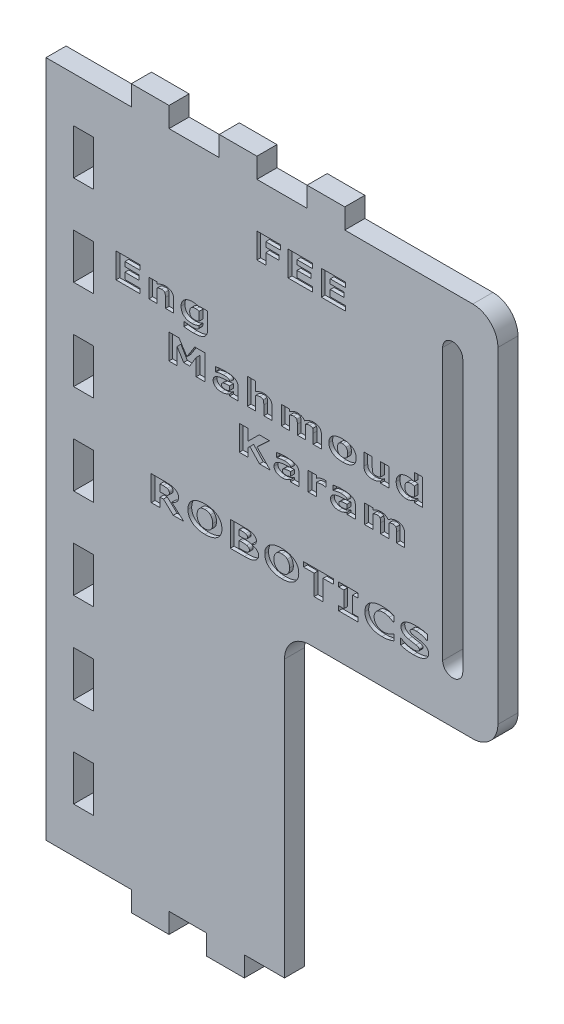
from build123d import *

# Parameters (mm, degrees)
BOSS_EXTRUDE1_DEPTH = 8
CUT_EXTRUDE1_DEPTH  = 1.5
SKETCH4_W           = 8
SKETCH4_H           = 18
CUT_EXTRUDE2_DEPTH  = 178.732945874
SKETCH5_W           = 15
SKETCH5_H           = 8
BOSS_EXTRUDE2_DEPTH = 8
SKETCH6_W           = 15
SKETCH6_H           = 8
BOSS_EXTRUDE3_DEPTH = 8
CUT_EXTRUDE3_DEPTH  = 185.534549748


with BuildPart() as part:
    # Sketch1 → Boss-Extrude1 (new body)
    with BuildSketch(Plane.XY):
        with BuildLine():
            Line((-95, -120), (-95, 150))
            Line((-95, 150), (75, 150))
            ThreePointArc((75, 150), (82.071067812, 147.071067812), (85, 140))
            Line((85, 140), (85, 10))
            ThreePointArc((85, 10), (82.071067812, 2.928932188), (75, 0))
            Line((75, 0), (10, 0))
            ThreePointArc((10, 0), (2.928932188, -2.928932188), (0, -10))
            Line((0, -10), (0, -120))
            Line((0, -120), (-95, -120))
        make_face()
    extrude(amount=BOSS_EXTRUDE1_DEPTH)

    # Sketch3 → Cut-Extrude1 (cut)
    # profile 1 of 26: a face of its own
    with BuildSketch(Plane.XY.offset(8)):
        Polygon((-1.63958473, 130.277566344), (-7.462369541, 130.277566344), (-7.462369541, 128.378832167), (-2.145913844, 128.378832167), (-2.145913844, 126.48009799), (-7.462369541, 126.48009799), (-7.462369541, 122.176300522), (-11.006673338, 122.176300522), (-11.006673338, 132.176300522), (-1.63958473, 132.176300522), align=None)
    # profile 2 of 26: a face of its own
    with BuildSketch(Plane.XY.offset(8)):
        Polygon((1.449022864, 122.176300522), (1.449022864, 132.176300522), (11.069276029, 132.176300522), (11.069276029, 130.277566344), (4.993326662, 130.277566344), (4.993326662, 128.505414446), (10.562946915, 128.505414446), (10.562946915, 126.606680268), (4.993326662, 126.606680268), (4.993326662, 124.075034699), (11.069276029, 124.075034699), (11.069276029, 122.176300522), align=None)
    # profile 3 of 26: a face of its own
    with BuildSketch(Plane.XY.offset(8)):
        Polygon((14.664212738, 122.176300522), (14.664212738, 132.176300522), (24.284465902, 132.176300522), (24.284465902, 130.277566344), (18.208516535, 130.277566344), (18.208516535, 128.505414446), (23.778136789, 128.505414446), (23.778136789, 126.606680268), (18.208516535, 126.606680268), (18.208516535, 124.075034699), (24.284465902, 124.075034699), (24.284465902, 122.176300522), align=None)
    # profile 4 of 26: a face of its own
    with BuildSketch(Plane.XY.offset(8)):
        Polygon((-67.107939161, 87.264908116), (-67.107939161, 97.264908116), (-57.487685996, 97.264908116), (-57.487685996, 95.366173939), (-63.563635363, 95.366173939), (-63.563635363, 93.594022041), (-57.99401511, 93.594022041), (-57.99401511, 91.695287863), (-63.563635363, 91.695287863), (-63.563635363, 89.163642294), (-57.487685996, 89.163642294), (-57.487685996, 87.264908116), align=None)
    # profile 5 of 26: a face of its own
    with BuildSketch(Plane.XY.offset(8)):
        with BuildLine():
            Line((-44.145913844, 87.264908116), (-47.437053085, 87.264908116))
            Line((-47.437053085, 87.264908116), (-47.437053085, 91.022819509))
            add(Edge.make_bspline(
                [(-47.437053085, 91.022819509), (-47.439139379, 91.175845895), (-47.443301092, 91.481101057), (-47.476023247, 91.857272064), (-47.516185622, 92.141602587), (-47.555686359, 92.326478501), (-47.609714511, 92.481395597), (-47.659381686, 92.5687391), (-47.682306249, 92.609053686)],
                knots=[0, 0, 0, 0, 1.698886945, 3.388918872, 4.188144556, 4.886076773, 5.485853525, 6, 6, 6, 6], degree=3))
            add(Edge.make_bspline(
                [(-47.682306249, 92.609053686), (-47.711897734, 92.649804466), (-47.771184947, 92.731449584), (-47.886406044, 92.833321167), (-48.021482913, 92.914052489), (-48.174285052, 92.980404806), (-48.350026421, 93.029181638), (-48.550644472, 93.064473186), (-48.779025497, 93.082594712), (-48.940190824, 93.085931524), (-49.02526511, 93.087692927)],
                knots=[0, 0, 0, 0, 0.811124565, 1.625106561, 2.461054917, 3.342828608, 4.306180259, 5.397992397, 6.626479142, 8, 8, 8, 8], degree=3))
            add(Edge.make_bspline(
                [(-49.02526511, 93.087692927), (-49.161460506, 93.082117438), (-49.437497141, 93.070817209), (-49.780414404, 92.999614079), (-50.058306044, 92.918345656), (-50.276442129, 92.84095427), (-50.501397393, 92.746032006), (-50.651406503, 92.672437073), (-50.728192325, 92.634765711)],
                knots=[0, 0, 0, 0, 1.37798484, 2.792857252, 3.529917685, 4.308816571, 5.134326501, 6, 6, 6, 6], degree=3))
            Line((-50.728192325, 92.634765711), (-50.728192325, 87.264908116))
            Line((-50.728192325, 87.264908116), (-54.019331566, 87.264908116))
            Line((-54.019331566, 87.264908116), (-54.019331566, 94.733262547))
            Line((-54.019331566, 94.733262547), (-50.728192325, 94.733262547))
            Line((-50.728192325, 94.733262547), (-50.728192325, 93.950034699))
            add(Edge.make_bspline(
                [(-50.728192325, 93.950034699), (-50.595102567, 94.028496253), (-50.334227699, 94.182292066), (-49.937939629, 94.386008256), (-49.547471938, 94.562089172), (-49.160292468, 94.716027852), (-48.764030053, 94.84034636), (-48.34900057, 94.92331166), (-47.913774805, 94.976451686), (-47.616538932, 94.983054897), (-47.464742958, 94.986427104)],
                knots=[0, 0, 0, 0, 1.068006613, 2.093444971, 3.078801891, 4.028532812, 4.972921622, 5.945544555, 6.950806102, 8, 8, 8, 8], degree=3))
            add(Edge.make_bspline(
                [(-47.464742958, 94.986427104), (-47.334138261, 94.984075991), (-47.08038945, 94.97950807), (-46.712087296, 94.946405522), (-46.367774672, 94.888795058), (-46.046755283, 94.810403267), (-45.748300934, 94.709989104), (-45.473771528, 94.585979982), (-45.224858814, 94.435618639), (-44.997912984, 94.266241568), (-44.797563401, 94.072885212), (-44.621026474, 93.860409683), (-44.47558301, 93.624997191), (-44.352135636, 93.371350596), (-44.261329422, 93.095473969), (-44.193085481, 92.80038914), (-44.15395364, 92.484837472), (-44.148641575, 92.267651096), (-44.145913844, 92.156126471)],
                knots=[0, 0, 0, 0, 1.26143147, 2.450805703, 3.567830747, 4.630418912, 5.639310902, 6.605330152, 7.533609373, 8.44295519, 9.334694597, 10.216901788, 11.103853604, 12.00103326, 12.935408189, 13.902413398, 14.922894878, 16, 16, 16, 16], degree=3))
            Line((-44.145913844, 92.156126471), (-44.145913844, 87.264908116))
        make_face()
    # profile 6 of 26: a face of its own
    with BuildSketch(Plane.XY.offset(8)):
        with BuildLine():
            add(Edge.make_bspline(
                [(-30.677559414, 88.060003053), (-30.678294996, 87.974241195), (-30.679740412, 87.805719363), (-30.703086905, 87.558204693), (-30.736458296, 87.320568083), (-30.780571537, 87.091971919), (-30.843179025, 86.874533733), (-30.915645146, 86.665859009), (-31.002858641, 86.467376743), (-31.13714915, 86.218905759), (-31.330669869, 85.929946353), (-31.607033575, 85.622861172), (-31.921182337, 85.353015914), (-32.158026632, 85.210629746), (-32.277638528, 85.138721408)],
                knots=[0, 0, 0, 0, 0.880058464, 1.72931263, 2.549567236, 3.343286777, 4.116751974, 4.87020869, 5.609612982, 6.339352258, 7.767823634, 9.167318825, 10.569429897, 12, 12, 12, 12], degree=3))
            add(Edge.make_bspline(
                [(-32.277638528, 85.138721408), (-32.406312741, 85.071494192), (-32.669763719, 84.933851419), (-33.099827724, 84.772190051), (-33.564475902, 84.635575791), (-34.065586213, 84.531065873), (-34.597925869, 84.450765402), (-35.159670503, 84.394163326), (-35.75032346, 84.360453441), (-36.153516474, 84.355864738), (-36.359917009, 84.353515711)],
                knots=[0, 0, 0, 0, 0.829033638, 1.69738534, 2.620203445, 3.594935716, 4.620186773, 5.695814444, 6.820452943, 8, 8, 8, 8], degree=3))
            add(Edge.make_bspline(
                [(-36.359917009, 84.353515711), (-36.535302256, 84.354616894), (-36.881549553, 84.356790859), (-37.394614732, 84.37521116), (-37.893893846, 84.404175588), (-38.376473374, 84.446244816), (-38.835980304, 84.495319054), (-39.267005349, 84.549481604), (-39.667145555, 84.6026246), (-39.922141447, 84.646780116), (-40.044648022, 84.667993559)],
                knots=[0, 0, 0, 0, 1.136818235, 2.244317855, 3.32740714, 4.378249075, 5.383934538, 6.322671537, 7.19416833, 8, 8, 8, 8], degree=3))
            Line((-40.044648022, 84.667993559), (-40.044648022, 86.505414446))
            Line((-40.044648022, 86.505414446), (-39.651056249, 86.505414446))
            add(Edge.make_bspline(
                [(-39.651056249, 86.505414446), (-39.560066287, 86.486346852), (-39.363662676, 86.44518908), (-39.054049461, 86.37912826), (-38.719768496, 86.321117462), (-38.491396805, 86.283104809), (-38.377322072, 86.264116977)],
                knots=[0, 0, 0, 0, 0.860431276, 1.8572577, 2.929671379, 4, 4, 4, 4], degree=3))
            add(Edge.make_bspline(
                [(-38.377322072, 86.264116977), (-38.241572392, 86.245204177), (-37.973718306, 86.207886441), (-37.573208758, 86.160126647), (-37.171908789, 86.131669737), (-36.903210562, 86.127683232), (-36.767353718, 86.12566761)],
                knots=[0, 0, 0, 0, 1.016904028, 2.00650123, 2.992064607, 4, 4, 4, 4], degree=3))
            add(Edge.make_bspline(
                [(-36.767353718, 86.12566761), (-36.630823352, 86.126748156), (-36.370021492, 86.128812227), (-35.996610677, 86.156232064), (-35.658027287, 86.193087785), (-35.353944188, 86.250339976), (-35.085438789, 86.322719549), (-34.850888224, 86.407169834), (-34.651016748, 86.505268655), (-34.539273733, 86.588858693), (-34.486894857, 86.628041028)],
                knots=[0, 0, 0, 0, 1.379945189, 2.635987021, 3.783497997, 4.821423765, 5.760832745, 6.591654733, 7.339846506, 8, 8, 8, 8], degree=3))
            add(Edge.make_bspline(
                [(-34.486894857, 86.628041028), (-34.440618012, 86.66953449), (-34.349856163, 86.750914786), (-34.24044928, 86.894280998), (-34.146168422, 87.042863688), (-34.078841547, 87.207362262), (-34.030913435, 87.385861682), (-33.991708909, 87.579847065), (-33.974114696, 87.793335585), (-33.970554748, 87.941314614), (-33.968698654, 88.018468243)],
                knots=[0, 0, 0, 0, 0.968375451, 1.899255392, 2.804977998, 3.709295474, 4.660947371, 5.688573942, 6.79486363, 8, 8, 8, 8], degree=3))
            Line((-33.968698654, 88.018468243), (-33.968698654, 88.158895458))
            add(Edge.make_bspline(
                [(-33.968698654, 88.158895458), (-34.066176084, 88.102761639), (-34.264644691, 87.988470557), (-34.582787517, 87.840448571), (-34.92377474, 87.711081105), (-35.282352464, 87.596300369), (-35.655122967, 87.505786688), (-36.035738878, 87.440711555), (-36.422316365, 87.399777819), (-36.682206546, 87.394262668), (-36.812844224, 87.391490395)],
                knots=[0, 0, 0, 0, 0.905451352, 1.843541304, 2.821564556, 3.840694787, 4.873341123, 5.907569182, 6.948208424, 8, 8, 8, 8], degree=3))
            add(Edge.make_bspline(
                [(-36.812844224, 87.391490395), (-36.98240542, 87.393581885), (-37.312291277, 87.397650936), (-37.791784327, 87.445421848), (-38.242665562, 87.515847127), (-38.663029906, 87.621628655), (-39.054717323, 87.753404101), (-39.41724403, 87.914607647), (-39.746902869, 88.111183912), (-40.050453014, 88.331355), (-40.318479794, 88.586371833), (-40.552959339, 88.870890682), (-40.74655952, 89.189151961), (-40.908277392, 89.535682901), (-41.032462515, 89.914288315), (-41.120208568, 90.323308622), (-41.174558269, 90.762921729), (-41.180713616, 91.066168375), (-41.183888528, 91.222582167)],
                knots=[0, 0, 0, 0, 1.224871333, 2.38302005, 3.478781297, 4.519891353, 5.5112487, 6.462290434, 7.380695274, 8.280221636, 9.166542222, 10.046811101, 10.936658786, 11.851063462, 12.804738824, 13.809322055, 14.870054298, 16, 16, 16, 16], degree=3))
            add(Edge.make_bspline(
                [(-41.183888528, 91.222582167), (-41.179871046, 91.365891506), (-41.172014316, 91.646152301), (-41.105675593, 92.055446246), (-40.993910115, 92.441263508), (-40.841913808, 92.805879529), (-40.6458739, 93.143173741), (-40.420415598, 93.458682507), (-40.157215095, 93.746102874), (-39.95884796, 93.914492937), (-39.8587303, 93.999480901)],
                knots=[0, 0, 0, 0, 1.078500561, 2.109153708, 3.111422904, 4.096909377, 5.075206864, 6.042295939, 7.011929319, 8, 8, 8, 8], degree=3))
            add(Edge.make_bspline(
                [(-39.8587303, 93.999480901), (-39.756177976, 94.076411503), (-39.547476819, 94.232970661), (-39.198796234, 94.425552428), (-38.82193794, 94.595453481), (-38.417167448, 94.735590837), (-37.99194999, 94.847587666), (-37.555048911, 94.928644876), (-37.109318895, 94.977435262), (-36.809668937, 94.983412908), (-36.658572072, 94.986427104)],
                knots=[0, 0, 0, 0, 0.901729637, 1.835082925, 2.797087275, 3.810089436, 4.847110806, 5.890523085, 6.93630772, 8, 8, 8, 8], degree=3))
            add(Edge.make_bspline(
                [(-36.658572072, 94.986427104), (-36.524666208, 94.984807071), (-36.26371, 94.981649945), (-35.882616156, 94.94904467), (-35.522777649, 94.897579927), (-35.184396902, 94.819592536), (-34.863537366, 94.731384215), (-34.558929666, 94.628979288), (-34.266988081, 94.521821482), (-34.080381538, 94.439533399), (-33.988477136, 94.399006218)],
                knots=[0, 0, 0, 0, 1.165730047, 2.271778725, 3.328033871, 4.328049235, 5.293267386, 6.224564908, 7.125591743, 8, 8, 8, 8], degree=3))
            Line((-33.988477136, 94.399006218), (-33.865850553, 94.733262547))
            Line((-33.865850553, 94.733262547), (-30.677559414, 94.733262547))
            Line((-30.677559414, 94.733262547), (-30.677559414, 88.060003053))
        make_face()
        with BuildLine():
            Line((-33.968698654, 89.582946091), (-33.968698654, 93.024401787))
            add(Edge.make_bspline(
                [(-33.968698654, 93.024401787), (-34.012727325, 93.038104199), (-34.105323695, 93.066921641), (-34.253509378, 93.101359018), (-34.4157906, 93.133114627), (-34.650288805, 93.16901428), (-34.953214384, 93.206780369), (-35.198781699, 93.211777179), (-35.321546756, 93.214275205)],
                knots=[0, 0, 0, 0, 0.605369744, 1.273148621, 1.996481829, 2.776506728, 4.388497529, 6, 6, 6, 6], degree=3))
            add(Edge.make_bspline(
                [(-35.321546756, 93.214275205), (-35.419840211, 93.212996387), (-35.610853843, 93.210511262), (-35.88782024, 93.184501519), (-36.14594911, 93.141961601), (-36.384548693, 93.080050005), (-36.605588648, 93.003577159), (-36.808308859, 92.908938935), (-36.991256681, 92.795705158), (-37.154952712, 92.666004), (-37.29979134, 92.521441048), (-37.425422509, 92.362161187), (-37.530388084, 92.189215143), (-37.616537798, 92.002726569), (-37.682655305, 91.802801688), (-37.733645586, 91.589360738), (-37.760007992, 91.361696226), (-37.764083877, 91.205498335), (-37.766167009, 91.12566761)],
                knots=[0, 0, 0, 0, 1.288074726, 2.503115079, 3.642507189, 4.713553121, 5.730264709, 6.704439651, 7.639699785, 8.543943667, 9.436090235, 10.316058051, 11.196407677, 12.081832382, 13.002769896, 13.952333231, 14.953463954, 16, 16, 16, 16], degree=3))
            add(Edge.make_bspline(
                [(-37.766167009, 91.12566761), (-37.765161851, 91.046513315), (-37.763224161, 90.893923965), (-37.744810103, 90.674745512), (-37.718083567, 90.474382094), (-37.679599683, 90.2907977), (-37.621586845, 90.122812783), (-37.544853208, 89.965318648), (-37.449022156, 89.817249637), (-37.370447943, 89.728384894), (-37.331040427, 89.683816344)],
                knots=[0, 0, 0, 0, 1.2281697, 2.367598838, 3.410865862, 4.364158712, 5.273386138, 6.161116887, 7.077740489, 8, 8, 8, 8], degree=3))
            add(Edge.make_bspline(
                [(-37.331040427, 89.683816344), (-37.288608131, 89.642324761), (-37.202815935, 89.558434555), (-37.051095409, 89.453883549), (-36.883241921, 89.362295495), (-36.693662291, 89.28896099), (-36.482395677, 89.231164525), (-36.244906152, 89.193967457), (-35.981453044, 89.166812764), (-35.796312231, 89.164732275), (-35.699315743, 89.163642294)],
                knots=[0, 0, 0, 0, 0.80726776, 1.632183073, 2.500322045, 3.407722665, 4.39484755, 5.478744933, 6.679097917, 8, 8, 8, 8], degree=3))
            add(Edge.make_bspline(
                [(-35.699315743, 89.163642294), (-35.54864767, 89.169235583), (-35.247895926, 89.180400466), (-34.803644248, 89.262248906), (-34.37323513, 89.392335716), (-34.103165284, 89.519587813), (-33.968698654, 89.582946091)],
                knots=[0, 0, 0, 0, 1.005981165, 2.008060392, 3.008221727, 4, 4, 4, 4], degree=3))
        make_face(mode=Mode.SUBTRACT)
    # profile 7 of 26: a face of its own
    with BuildSketch(Plane.XY.offset(8)):
        Polygon((-31.63958473, 69.809211914), (-35.183888528, 69.809211914), (-35.183888528, 76.462692927), (-37.766958148, 72.214275205), (-40.195755617, 72.214275205), (-42.778825237, 76.462692927), (-42.778825237, 69.809211914), (-46.069964477, 69.809211914), (-46.069964477, 79.809211914), (-42.02526511, 79.809211914), (-38.880486629, 74.908104319), (-35.745597389, 79.809211914), (-31.63958473, 79.809211914), align=None)
    # profile 8 of 26: a face of its own
    with BuildSketch(Plane.XY.offset(8)):
        with BuildLine():
            add(Edge.make_bspline(
                [(-21.842116376, 70.604306851), (-21.948360555, 70.540528572), (-22.149410256, 70.41983863), (-22.396189687, 70.268621947), (-22.5954946, 70.1584133), (-22.762875042, 70.0777899), (-22.954390113, 69.999171129), (-23.089985372, 69.948574985), (-23.16134106, 69.921949256)],
                knots=[0, 0, 0, 0, 1.49806635, 2.834845104, 3.498274195, 4.250417468, 5.079299203, 6, 6, 6, 6], degree=3))
            add(Edge.make_bspline(
                [(-23.16134106, 69.921949256), (-23.305868626, 69.871016463), (-23.588426812, 69.771440459), (-23.951834238, 69.667467523), (-24.260968139, 69.608234511), (-24.532007221, 69.578283589), (-24.844188692, 69.558302919), (-25.066630852, 69.556829364), (-25.184679667, 69.556047357)],
                knots=[0, 0, 0, 0, 1.332293329, 2.604696069, 3.281454776, 4.066376344, 4.97383669, 6, 6, 6, 6], degree=3))
            add(Edge.make_bspline(
                [(-25.184679667, 69.556047357), (-25.298808258, 69.557730706), (-25.522252744, 69.561026418), (-25.849518385, 69.593141362), (-26.161312079, 69.646885406), (-26.459237453, 69.719407943), (-26.743171529, 69.814493146), (-27.012236629, 69.931420681), (-27.267112514, 70.067835946), (-27.502937123, 70.225600113), (-27.718092705, 70.398331858), (-27.907517096, 70.584275621), (-28.066820366, 70.782872495), (-28.196496706, 70.992331058), (-28.298745461, 71.211948045), (-28.372336595, 71.443023149), (-28.417103036, 71.685770606), (-28.421943532, 71.851480019), (-28.424394857, 71.935398623)],
                knots=[0, 0, 0, 0, 1.224843961, 2.398037382, 3.525447814, 4.618826151, 5.686337956, 6.735487888, 7.764586985, 8.78525621, 9.776677374, 10.722492462, 11.628799342, 12.502752739, 13.360830786, 14.222520093, 15.099848171, 16, 16, 16, 16], degree=3))
            add(Edge.make_bspline(
                [(-28.424394857, 71.935398623), (-28.422816974, 72.004028672), (-28.41972894, 72.138342722), (-28.397299729, 72.334676276), (-28.3627917, 72.5216749), (-28.310442288, 72.698038708), (-28.246384456, 72.865249089), (-28.163263932, 73.020474328), (-28.069337146, 73.167093719), (-27.958822609, 73.303333198), (-27.833098327, 73.428992352), (-27.697064774, 73.550157328), (-27.54718898, 73.663194855), (-27.385167493, 73.77042855), (-27.20846102, 73.868451493), (-27.02026875, 73.961271126), (-26.820267068, 74.049521052), (-26.680278244, 74.099389056), (-26.6087303, 74.124876471)],
                knots=[0, 0, 0, 0, 1.071683202, 2.097362782, 3.082870057, 4.037611031, 4.96691468, 5.874281361, 6.782524021, 7.683087702, 8.607816289, 9.556150094, 10.526150263, 11.537149005, 12.58830409, 13.679692425, 14.81409649, 16, 16, 16, 16], degree=3))
            add(Edge.make_bspline(
                [(-26.6087303, 74.124876471), (-26.453827479, 74.175461745), (-26.132827347, 74.280287981), (-25.620435369, 74.393938617), (-25.067191978, 74.493240742), (-24.472745224, 74.559294411), (-23.845343406, 74.615110662), (-23.192669874, 74.667007779), (-22.516126716, 74.710234171), (-22.057728749, 74.733880322), (-21.824315743, 74.745920775)],
                knots=[0, 0, 0, 0, 0.807663841, 1.673695794, 2.599837877, 3.594206959, 4.638211308, 5.72373783, 6.840943389, 8, 8, 8, 8], degree=3))
            Line((-21.824315743, 74.745920775), (-21.824315743, 74.785477737))
            add(Edge.make_bspline(
                [(-21.824315743, 74.785477737), (-21.826065933, 74.835734521), (-21.829438717, 74.93258417), (-21.859733182, 75.072536844), (-21.911439575, 75.199157212), (-21.982212022, 75.315379595), (-22.073785899, 75.417825743), (-22.185115939, 75.50874792), (-22.317079212, 75.585278264), (-22.468869476, 75.650262612), (-22.640380003, 75.704265782), (-22.830906301, 75.754396298), (-23.041810269, 75.794717046), (-23.272762046, 75.828465883), (-23.522905241, 75.853633498), (-23.793416845, 75.870616748), (-24.083560738, 75.883228389), (-24.284084519, 75.884503165), (-24.387606882, 75.885161281)],
                knots=[0, 0, 0, 0, 0.777795964, 1.498887486, 2.204334614, 2.887399943, 3.596386126, 4.322090836, 5.104965246, 5.951090239, 6.874705083, 7.887762051, 9.001300404, 10.198555308, 11.502266546, 12.894147342, 14.396573193, 16, 16, 16, 16], degree=3))
            add(Edge.make_bspline(
                [(-24.387606882, 75.885161281), (-24.488544036, 75.883851402), (-24.6986888, 75.881124317), (-25.025757227, 75.849889127), (-25.377790149, 75.808105338), (-25.876450212, 75.720984483), (-26.509491279, 75.590250902), (-27.009001424, 75.449061614), (-27.257464477, 75.378832167)],
                knots=[0, 0, 0, 0, 0.62141117, 1.293738708, 2.021939733, 2.804227678, 4.41037994, 6, 6, 6, 6], degree=3))
            Line((-27.257464477, 75.378832167), (-27.538318908, 75.378832167))
            Line((-27.538318908, 75.378832167), (-27.538318908, 77.162851154))
            add(Edge.make_bspline(
                [(-27.538318908, 77.162851154), (-27.494853049, 77.171674287), (-27.401565906, 77.190610639), (-27.250940633, 77.215381431), (-27.081499589, 77.24300654), (-26.893752202, 77.273028266), (-26.68737856, 77.302722219), (-26.462373597, 77.33166132), (-26.218464011, 77.363500953), (-25.868197042, 77.408951846), (-25.415625474, 77.459043169), (-24.866707023, 77.499193802), (-24.315369422, 77.526800964), (-23.947240132, 77.529418227), (-23.762606882, 77.530730901)],
                knots=[0, 0, 0, 0, 0.420292634, 0.902038965, 1.446442061, 2.047357487, 2.703875568, 3.422289323, 4.197270647, 5.035018213, 6.76962911, 8.511527637, 10.25037559, 12, 12, 12, 12], degree=3))
            add(Edge.make_bspline(
                [(-23.762606882, 77.530730901), (-23.543037196, 77.528903159), (-23.119505737, 77.525377597), (-22.507099689, 77.496553873), (-21.941804522, 77.444683672), (-21.421774788, 77.377881816), (-20.948380602, 77.286737959), (-20.519728411, 77.178565548), (-20.138618584, 77.045261082), (-19.800233992, 76.896757145), (-19.506847582, 76.722305382), (-19.249457191, 76.531197208), (-19.03471828, 76.313090176), (-18.855357066, 76.076164798), (-18.717956619, 75.816150435), (-18.61990301, 75.534940456), (-18.562231944, 75.232184905), (-18.554787957, 75.02306901), (-18.550977136, 74.916015711)],
                knots=[0, 0, 0, 0, 1.617124422, 3.119297016, 4.513748841, 5.797238919, 6.979046522, 8.062549321, 9.049973511, 9.94974334, 10.77917004, 11.559002271, 12.304076598, 13.025631621, 13.740275212, 14.460505635, 15.211882247, 16, 16, 16, 16], degree=3))
            Line((-18.550977136, 74.916015711), (-18.550977136, 69.809211914))
            Line((-18.550977136, 69.809211914), (-21.842116376, 69.809211914))
            Line((-21.842116376, 69.809211914), (-21.842116376, 70.604306851))
        make_face()
        with BuildLine():
            Line((-21.842116376, 71.749480901), (-21.842116376, 73.353515711))
            add(Edge.make_bspline(
                [(-21.842116376, 73.353515711), (-21.97529629, 73.343684953), (-22.228494033, 73.324995003), (-22.587819173, 73.297565609), (-22.907555765, 73.271375854), (-23.279504181, 73.241523722), (-23.716188774, 73.191618738), (-24.051984325, 73.112251951), (-24.219489794, 73.072661281)],
                knots=[0, 0, 0, 0, 1.002692256, 1.90628907, 2.705864121, 3.411297121, 4.708672917, 6, 6, 6, 6], degree=3))
            add(Edge.make_bspline(
                [(-24.219489794, 73.072661281), (-24.287755788, 73.052713036), (-24.419023379, 73.014354873), (-24.602400201, 72.940729088), (-24.760216822, 72.848574693), (-24.895255989, 72.744416161), (-25.003172863, 72.62180703), (-25.080276783, 72.48021377), (-25.124235226, 72.319022878), (-25.130164024, 72.205976691), (-25.133255617, 72.14702837)],
                knots=[0, 0, 0, 0, 1.204993502, 2.317062773, 3.338387959, 4.292810683, 5.195618751, 6.085476175, 7.00166499, 8, 8, 8, 8], degree=3))
            add(Edge.make_bspline(
                [(-25.133255617, 72.14702837), (-25.1325106, 72.103395094), (-25.131079661, 72.019589532), (-25.109232511, 71.900068338), (-25.081895084, 71.789000037), (-25.03494295, 71.690892474), (-24.979519101, 71.601045931), (-24.908938913, 71.523931429), (-24.827693279, 71.455638952), (-24.695673898, 71.379256281), (-24.49865299, 71.304461706), (-24.223151406, 71.246501925), (-23.902244334, 71.205863191), (-23.67177643, 71.203092831), (-23.548999287, 71.201616977)],
                knots=[0, 0, 0, 0, 0.74525627, 1.431398858, 2.074464334, 2.695280691, 3.283579496, 3.874683336, 4.475501678, 5.092617772, 6.47511076, 8.059555353, 9.900807333, 12, 12, 12, 12], degree=3))
            add(Edge.make_bspline(
                [(-23.548999287, 71.201616977), (-23.476422682, 71.203932929), (-23.329530508, 71.208620324), (-23.108310024, 71.233943233), (-22.885148317, 71.280835309), (-22.661888531, 71.343752758), (-22.441553511, 71.421046676), (-22.232071383, 71.517897017), (-22.029952915, 71.623150602), (-21.904683093, 71.707401377), (-21.842116376, 71.749480901)],
                knots=[0, 0, 0, 0, 0.95781264, 1.938574828, 2.933126429, 3.963070631, 4.997559481, 6.009719137, 7.005943021, 8, 8, 8, 8], degree=3))
        make_face(mode=Mode.SUBTRACT)
    # profile 9 of 26: a face of its own
    with BuildSketch(Plane.XY.offset(8)):
        with BuildLine():
            Line((-4.956040427, 69.809211914), (-8.247179667, 69.809211914))
            Line((-8.247179667, 69.809211914), (-8.247179667, 73.567123306))
            add(Edge.make_bspline(
                [(-8.247179667, 73.567123306), (-8.249265961, 73.720149693), (-8.253427674, 74.025404855), (-8.286149829, 74.401575862), (-8.326312205, 74.685906384), (-8.365812941, 74.870782299), (-8.419841093, 75.025699394), (-8.469508269, 75.113042897), (-8.492432832, 75.153357484)],
                knots=[0, 0, 0, 0, 1.698886945, 3.388918872, 4.188144556, 4.886076773, 5.485853525, 6, 6, 6, 6], degree=3))
            add(Edge.make_bspline(
                [(-8.492432832, 75.153357484), (-8.522024316, 75.194108264), (-8.581311529, 75.275753381), (-8.696532626, 75.377624964), (-8.831609495, 75.458356287), (-8.984411635, 75.524708604), (-9.160153003, 75.573485435), (-9.360771054, 75.608776983), (-9.589152079, 75.626898509), (-9.750317407, 75.630235322), (-9.835391692, 75.631996724)],
                knots=[0, 0, 0, 0, 0.811124565, 1.625106561, 2.461054917, 3.342828608, 4.306180259, 5.397992397, 6.626479142, 8, 8, 8, 8], degree=3))
            add(Edge.make_bspline(
                [(-9.835391692, 75.631996724), (-9.971587088, 75.626421235), (-10.247623724, 75.615121007), (-10.590540986, 75.543917876), (-10.868432626, 75.462649454), (-11.086568711, 75.385258068), (-11.311523975, 75.290335803), (-11.461533085, 75.216740871), (-11.538318908, 75.179069509)],
                knots=[0, 0, 0, 0, 1.37798484, 2.792857252, 3.529917685, 4.308816571, 5.134326501, 6, 6, 6, 6], degree=3))
            Line((-11.538318908, 75.179069509), (-11.538318908, 69.809211914))
            Line((-11.538318908, 69.809211914), (-14.829458148, 69.809211914))
            Line((-14.829458148, 69.809211914), (-14.829458148, 80.188958749))
            Line((-14.829458148, 80.188958749), (-11.538318908, 80.188958749))
            Line((-11.538318908, 80.188958749), (-11.538318908, 76.494338496))
            add(Edge.make_bspline(
                [(-11.538318908, 76.494338496), (-11.405229149, 76.57280005), (-11.144354281, 76.726595863), (-10.748066211, 76.930312054), (-10.35759852, 77.106392969), (-9.97041905, 77.260331649), (-9.574156636, 77.384650157), (-9.159127152, 77.467615458), (-8.723901388, 77.520755483), (-8.426665514, 77.527358694), (-8.274869541, 77.530730901)],
                knots=[0, 0, 0, 0, 1.068006613, 2.093444971, 3.078801891, 4.028532812, 4.972921622, 5.945544555, 6.950806102, 8, 8, 8, 8], degree=3))
            add(Edge.make_bspline(
                [(-8.274869541, 77.530730901), (-8.144264844, 77.528379789), (-7.890516032, 77.523811867), (-7.522213878, 77.49070932), (-7.177901255, 77.433098856), (-6.856881865, 77.354707064), (-6.558427516, 77.254292901), (-6.28389811, 77.13028378), (-6.034985396, 76.979922437), (-5.808039566, 76.810545366), (-5.607689984, 76.61718901), (-5.431153057, 76.40471348), (-5.285709592, 76.169300989), (-5.162262219, 75.915654393), (-5.071456004, 75.639777766), (-5.003212063, 75.344692938), (-4.964080222, 75.02914127), (-4.958768158, 74.811954893), (-4.956040427, 74.700430268)],
                knots=[0, 0, 0, 0, 1.26143147, 2.450805703, 3.567830747, 4.630418912, 5.639310902, 6.605330152, 7.533609373, 8.44295519, 9.334694597, 10.216901788, 11.103853604, 12.00103326, 12.935408189, 13.902413398, 14.922894878, 16, 16, 16, 16], degree=3))
            Line((-4.956040427, 74.700430268), (-4.956040427, 69.809211914))
        make_face()
    # profile 10 of 26: a face of its own
    with BuildSketch(Plane.XY.offset(8)):
        with BuildLine():
            Line((11.423706409, 69.809211914), (11.423706409, 73.59481318))
            add(Edge.make_bspline(
                [(11.423706409, 73.59481318), (11.423428379, 73.684481518), (11.422894741, 73.856587112), (11.416091307, 74.103147889), (11.409474629, 74.328102772), (11.396122509, 74.532085324), (11.375227593, 74.717277582), (11.343621558, 74.885258108), (11.29204149, 75.03449538), (11.246037516, 75.124146685), (11.223943751, 75.16720242)],
                knots=[0, 0, 0, 0, 1.344197728, 2.57999594, 3.69753542, 4.717888235, 5.643464705, 6.49051346, 7.275057357, 8, 8, 8, 8], degree=3))
            add(Edge.make_bspline(
                [(11.223943751, 75.16720242), (11.198303114, 75.205899024), (11.146835284, 75.283573778), (11.043636822, 75.380571892), (10.92206247, 75.461606513), (10.77853425, 75.524464515), (10.610588337, 75.57426954), (10.414265638, 75.608782561), (10.187895494, 75.626977737), (10.027377446, 75.630258058), (9.942298181, 75.631996724)],
                knots=[0, 0, 0, 0, 0.778280672, 1.562223931, 2.361532479, 3.224765785, 4.185599827, 5.300947593, 6.569423197, 8, 8, 8, 8], degree=3))
            add(Edge.make_bspline(
                [(9.942298181, 75.631996724), (9.815810961, 75.626446269), (9.5616993, 75.615295455), (9.249201493, 75.534813611), (8.999241624, 75.448486586), (8.801998286, 75.369539024), (8.594978111, 75.282527163), (8.456589896, 75.214103902), (8.385731725, 75.179069509)],
                knots=[0, 0, 0, 0, 1.390132188, 2.792762781, 3.52932861, 4.301385218, 5.13026744, 6, 6, 6, 6], degree=3))
            Line((8.385731725, 75.179069509), (8.385731725, 69.809211914))
            Line((8.385731725, 69.809211914), (5.094592485, 69.809211914))
            Line((5.094592485, 69.809211914), (5.094592485, 73.59481318))
            add(Edge.make_bspline(
                [(5.094592485, 73.59481318), (5.094161172, 73.683815777), (5.093333584, 73.854590586), (5.088513739, 74.100634132), (5.075090965, 74.325359258), (5.063648813, 74.530183732), (5.040956901, 74.716428069), (5.003146103, 74.883645049), (4.956045703, 75.035422151), (4.908091501, 75.124296453), (4.884940586, 75.16720242)],
                knots=[0, 0, 0, 0, 1.333121075, 2.557942181, 3.685216068, 4.7046563, 5.630616772, 6.490679902, 7.271343484, 8, 8, 8, 8], degree=3))
            add(Edge.make_bspline(
                [(4.884940586, 75.16720242), (4.859299916, 75.205898838), (4.807832019, 75.28357322), (4.704634067, 75.38057416), (4.583057683, 75.461597531), (4.439537996, 75.524502779), (4.272800281, 75.573730182), (4.078630711, 75.609080816), (3.855472344, 75.62685478), (3.696939866, 75.630219226), (3.613184257, 75.631996724)],
                knots=[0, 0, 0, 0, 0.783668759, 1.573039305, 2.377881517, 3.247091042, 4.214576997, 5.315691381, 6.581830638, 8, 8, 8, 8], degree=3))
            add(Edge.make_bspline(
                [(3.613184257, 75.631996724), (3.545847819, 75.630640684), (3.410682385, 75.627918684), (3.209735923, 75.600631107), (3.010219252, 75.560060863), (2.750081451, 75.478125345), (2.429461585, 75.355676119), (2.181164679, 75.238064195), (2.056617801, 75.179069509)],
                knots=[0, 0, 0, 0, 0.740471289, 1.486359049, 2.227576119, 2.97796527, 4.484133386, 6, 6, 6, 6], degree=3))
            Line((2.056617801, 75.179069509), (2.056617801, 69.809211914))
            Line((2.056617801, 69.809211914), (-1.234521439, 69.809211914))
            Line((-1.234521439, 69.809211914), (-1.234521439, 77.277566344))
            Line((-1.234521439, 77.277566344), (2.056617801, 77.277566344))
            Line((2.056617801, 77.277566344), (2.056617801, 76.494338496))
            add(Edge.make_bspline(
                [(2.056617801, 76.494338496), (2.189197886, 76.572515562), (2.447028027, 76.724547474), (2.833891232, 76.929574979), (3.210112765, 77.104937003), (3.578196659, 77.259967488), (3.953232502, 77.384670836), (4.347284626, 77.467846256), (4.762847552, 77.520837567), (5.047615003, 77.52737973), (5.19348489, 77.530730901)],
                knots=[0, 0, 0, 0, 1.102442046, 2.143932766, 3.134799758, 4.074974121, 5.00390794, 5.960788781, 6.95543009, 8, 8, 8, 8], degree=3))
            add(Edge.make_bspline(
                [(5.19348489, 77.530730901), (5.350611348, 77.527356738), (5.655592724, 77.520807511), (6.098403347, 77.457973876), (6.511980372, 77.356280017), (6.834322797, 77.234949572), (7.074208272, 77.117941057), (7.242595129, 77.021542942), (7.399413943, 76.913713115), (7.546942675, 76.797606163), (7.680538457, 76.668455856), (7.804916301, 76.530931164), (7.917205356, 76.382785889), (7.984258575, 76.277899053), (8.017851978, 76.225351154)],
                knots=[0, 0, 0, 0, 1.735225632, 3.368061027, 4.929855153, 6.432957696, 7.162711398, 7.87740338, 8.574467273, 9.26387678, 9.949117367, 10.624844593, 11.311052461, 12, 12, 12, 12], degree=3))
            add(Edge.make_bspline(
                [(8.017851978, 76.225351154), (8.173151858, 76.325781819), (8.475009044, 76.520989425), (8.931505855, 76.780573923), (9.374017276, 77.003808256), (9.803815481, 77.195813695), (10.229520842, 77.347077929), (10.657597499, 77.451622489), (11.088703691, 77.517813712), (11.377982644, 77.526425634), (11.522598814, 77.530730901)],
                knots=[0, 0, 0, 0, 1.169368049, 2.272906765, 3.318902774, 4.302693948, 5.248102807, 6.171307641, 7.08580115, 8, 8, 8, 8], degree=3))
            add(Edge.make_bspline(
                [(11.522598814, 77.530730901), (11.642002065, 77.529083674), (11.874661223, 77.525874024), (12.214402492, 77.493641726), (12.53494595, 77.440636677), (12.836539237, 77.367637165), (13.118533671, 77.275656933), (13.378567908, 77.161008198), (13.616491129, 77.024759159), (13.758664669, 76.915897406), (13.8287697, 76.862218243)],
                knots=[0, 0, 0, 0, 1.170360677, 2.280466622, 3.34201583, 4.353174033, 5.319976201, 6.245989209, 7.135106433, 8, 8, 8, 8], degree=3))
            add(Edge.make_bspline(
                [(13.8287697, 76.862218243), (13.899511848, 76.80049593), (14.038967932, 76.678820911), (14.220099673, 76.470615397), (14.373545309, 76.245643619), (14.50106131, 76.000015879), (14.598699386, 75.72606614), (14.666939598, 75.417272901), (14.707756919, 75.071383276), (14.712411868, 74.827789949), (14.714845649, 74.700430268)],
                knots=[0, 0, 0, 0, 0.928072522, 1.829536766, 2.721534004, 3.617220787, 4.560212559, 5.590415684, 6.740179404, 8, 8, 8, 8], degree=3))
            Line((14.714845649, 74.700430268), (14.714845649, 69.809211914))
            Line((14.714845649, 69.809211914), (11.423706409, 69.809211914))
        make_face()
    # profile 11 of 26: a face of its own
    with BuildSketch(Plane.XY.offset(8)):
        with BuildLine():
            add(Edge.make_bspline(
                [(28.562946915, 73.539433433), (28.55919836, 73.388837446), (28.551875216, 73.094634394), (28.482036829, 72.666213207), (28.372375101, 72.261394287), (28.215105171, 71.881428796), (28.01328587, 71.526438244), (27.768631159, 71.195367532), (27.476332606, 70.891302287), (27.141907705, 70.612905724), (26.766312038, 70.363643977), (26.353916334, 70.145411189), (25.903139294, 69.964180406), (25.417611886, 69.814082497), (24.89502289, 69.697714193), (24.33567327, 69.616766918), (23.740011706, 69.563351091), (23.330342278, 69.558525896), (23.11990894, 69.556047357)],
                knots=[0, 0, 0, 0, 0.949895019, 1.855706919, 2.732017872, 3.592143124, 4.443801007, 5.303553716, 6.18361129, 7.099508937, 8.044762093, 9.023913022, 10.039320425, 11.10678177, 12.228422367, 13.414871517, 14.672106883, 16, 16, 16, 16], degree=3))
            add(Edge.make_bspline(
                [(23.11990894, 69.556047357), (22.91079388, 69.558522599), (22.50375651, 69.563340596), (21.91138507, 69.616835685), (21.354089762, 69.698012581), (20.83259678, 69.81360596), (20.347566934, 69.965091831), (19.896156082, 70.144748283), (19.483186625, 70.364346995), (19.105996736, 70.61217805), (18.771233142, 70.89186119), (18.477441196, 71.195937328), (18.228155297, 71.525192918), (18.026730191, 71.881533983), (17.869955005, 72.261700047), (17.757138836, 72.665858596), (17.688122237, 73.094682487), (17.680680318, 73.388853729), (17.676870966, 73.539433433)],
                knots=[0, 0, 0, 0, 1.320266662, 2.569866896, 3.752821742, 4.875051939, 5.9390985, 6.958897145, 7.938562773, 8.887779905, 9.804159001, 10.687558684, 11.552746687, 12.404852251, 13.265429635, 14.143317613, 15.04960566, 16, 16, 16, 16], degree=3))
            add(Edge.make_bspline(
                [(17.676870966, 73.539433433), (17.680741135, 73.691319654), (17.688319659, 73.98874163), (17.756638077, 74.42163315), (17.869967418, 74.829006777), (18.026784712, 75.211066252), (18.227544773, 75.569210976), (18.477602262, 75.898594736), (18.770551239, 76.20299487), (19.106794209, 76.480176969), (19.482521903, 76.728912755), (19.896828334, 76.94532345), (20.347094616, 77.12636845), (20.833027671, 77.274483944), (21.35403302, 77.39079698), (21.911293581, 77.472511447), (22.503867919, 77.522741242), (22.910812675, 77.528019056), (23.11990894, 77.530730901)],
                knots=[0, 0, 0, 0, 0.957159284, 1.87429909, 2.754768141, 3.617794546, 4.472137998, 5.335924884, 6.217893959, 7.130131639, 8.077811574, 9.053954316, 10.072101463, 11.133196123, 12.25360894, 13.434648067, 14.681871425, 16, 16, 16, 16], degree=3))
            add(Edge.make_bspline(
                [(23.11990894, 77.530730901), (23.329683605, 77.528258565), (23.738037904, 77.523445834), (24.332373, 77.469898523), (24.891037773, 77.388983707), (25.413145083, 77.273144454), (25.89820845, 77.121724191), (26.349513631, 76.941912395), (26.762366451, 76.723099856), (27.137829194, 76.473770407), (27.473203409, 76.195589977), (27.763960614, 75.888909918), (28.011298085, 75.558547556), (28.215336914, 75.203857617), (28.372646114, 74.822802714), (28.482004419, 74.416578069), (28.551879705, 73.986201087), (28.559200076, 73.690688052), (28.562946915, 73.539433433)],
                knots=[0, 0, 0, 0, 1.322789292, 2.574985377, 3.760588634, 4.881429543, 5.944158847, 6.962695013, 7.941147845, 8.885727072, 9.800971718, 10.683414962, 11.545036854, 12.398147397, 13.257659413, 14.137354951, 15.046628631, 16, 16, 16, 16], degree=3))
        make_face()
        with BuildLine():
            add(Edge.make_bspline(
                [(25.145225396, 73.525588496), (25.14331221, 73.633771915), (25.139642369, 73.841287468), (25.112394049, 74.138890321), (25.066403949, 74.408595947), (24.99881302, 74.650130701), (24.91441707, 74.86501172), (24.820654517, 75.059697788), (24.708396698, 75.230429259), (24.620309854, 75.329028417), (24.577582991, 75.376854319)],
                knots=[0, 0, 0, 0, 1.308707692, 2.510340348, 3.611867432, 4.614367406, 5.538645642, 6.401884801, 7.224828063, 8, 8, 8, 8], degree=3))
            add(Edge.make_bspline(
                [(24.577582991, 75.376854319), (24.529989299, 75.422469534), (24.436501504, 75.512071027), (24.27705568, 75.620392129), (24.111627252, 75.711198087), (23.934060557, 75.775470494), (23.74804625, 75.825286365), (23.550276143, 75.860924581), (23.339159965, 75.879860818), (23.194442836, 75.883359401), (23.11990894, 75.885161281)],
                knots=[0, 0, 0, 0, 0.994750232, 1.953977565, 2.90358091, 3.840127771, 4.7997691, 5.812279273, 6.873254678, 8, 8, 8, 8], degree=3))
            add(Edge.make_bspline(
                [(23.11990894, 75.885161281), (23.049993707, 75.884019888), (22.913223937, 75.881787069), (22.712814361, 75.864398545), (22.522608506, 75.832243206), (22.341511765, 75.789542548), (22.16759944, 75.730584219), (22.003450405, 75.646131372), (21.844643453, 75.540773403), (21.74888765, 75.454626793), (21.699814004, 75.410477737)],
                knots=[0, 0, 0, 0, 1.090931256, 2.134104537, 3.135345247, 4.098494551, 5.035521382, 5.992497295, 6.97118007, 8, 8, 8, 8], degree=3))
            add(Edge.make_bspline(
                [(21.699814004, 75.410477737), (21.654837377, 75.363550655), (21.562196625, 75.266892447), (21.447511755, 75.093428648), (21.341762863, 74.899649479), (21.252459808, 74.679589086), (21.181279896, 74.43247164), (21.131301653, 74.156186693), (21.099025517, 73.850718819), (21.096112861, 73.637096915), (21.094592485, 73.525588496)],
                knots=[0, 0, 0, 0, 0.766301541, 1.578392079, 2.445929594, 3.371360745, 4.376771987, 5.477886051, 6.683482668, 8, 8, 8, 8], degree=3))
            add(Edge.make_bspline(
                [(21.094592485, 73.525588496), (21.096172581, 73.414731812), (21.099179242, 73.203789989), (21.130111135, 72.90391853), (21.173648059, 72.635932334), (21.24549184, 72.401972248), (21.328068446, 72.194807002), (21.427184422, 72.013609022), (21.528761767, 71.847615717), (21.613277145, 71.754935626), (21.654323497, 71.709923939)],
                knots=[0, 0, 0, 0, 1.365960024, 2.599194623, 3.713558242, 4.706065108, 5.610076611, 6.457209056, 7.250716942, 8, 8, 8, 8], degree=3))
            add(Edge.make_bspline(
                [(21.654323497, 71.709923939), (21.69885277, 71.667922889), (21.788528024, 71.583339095), (21.941835752, 71.476128695), (22.112318575, 71.389460557), (22.296391273, 71.317842718), (22.494384945, 71.265769649), (22.703343039, 71.227918341), (22.92233953, 71.206587987), (23.071737568, 71.203291079), (23.147598814, 71.201616977)],
                knots=[0, 0, 0, 0, 0.905947451, 1.8244418, 2.759199415, 3.733134394, 4.744730603, 5.786839634, 6.876202755, 8, 8, 8, 8], degree=3))
            add(Edge.make_bspline(
                [(23.147598814, 71.201616977), (23.27796667, 71.207418938), (23.543108342, 71.219218945), (23.868061257, 71.297636358), (24.118629487, 71.386145169), (24.288955132, 71.471591864), (24.440964563, 71.570013343), (24.525933875, 71.650559454), (24.567693751, 71.690145458)],
                knots=[0, 0, 0, 0, 1.524847215, 3.101228741, 3.889863382, 4.631956253, 5.327647416, 6, 6, 6, 6], degree=3))
            add(Edge.make_bspline(
                [(24.567693751, 71.690145458), (24.613832236, 71.739836115), (24.706442467, 71.839576347), (24.822256684, 72.009540914), (24.922140525, 72.19284473), (25.005507887, 72.395264588), (25.068354699, 72.62638858), (25.115916694, 72.891593784), (25.139017381, 73.19620439), (25.143075218, 73.411504592), (25.145225396, 73.525588496)],
                knots=[0, 0, 0, 0, 0.821701331, 1.649337841, 2.48688744, 3.351389502, 4.298498643, 5.38739656, 6.615626, 8, 8, 8, 8], degree=3))
        make_face(mode=Mode.SUBTRACT)
    # profile 12 of 26: a face of its own
    with BuildSketch(Plane.XY.offset(8)):
        with BuildLine():
            Line((41.524972232, 69.809211914), (38.233832991, 69.809211914))
            Line((38.233832991, 69.809211914), (38.233832991, 70.592439762))
            add(Edge.make_bspline(
                [(38.233832991, 70.592439762), (38.095404567, 70.511457153), (37.827410377, 70.354676717), (37.42658223, 70.146467526), (37.042965093, 69.968857303), (36.670817364, 69.813503572), (36.287756574, 69.696133084), (35.878600027, 69.613388696), (35.435735414, 69.564051004), (35.128741582, 69.558770976), (34.970383624, 69.556047357)],
                knots=[0, 0, 0, 0, 1.107578971, 2.14424697, 3.118075217, 4.027082663, 4.927322726, 5.880197416, 6.906533052, 8, 8, 8, 8], degree=3))
            add(Edge.make_bspline(
                [(34.970383624, 69.556047357), (34.843746851, 69.558610114), (34.596664788, 69.563610331), (34.236909603, 69.594129909), (33.898523368, 69.649921056), (33.581608669, 69.726542758), (33.284857823, 69.824428667), (33.011270877, 69.948895278), (32.755984345, 70.089611083), (32.525815429, 70.257304038), (32.318494427, 70.444907087), (32.139228005, 70.656476283), (31.987016358, 70.890112194), (31.865270816, 71.147547317), (31.766865545, 71.425508677), (31.701866926, 71.726655497), (31.65858634, 72.048856956), (31.653947864, 72.271479542), (31.65155451, 72.38634799)],
                knots=[0, 0, 0, 0, 1.222814521, 2.385843592, 3.482596049, 4.530931455, 5.531402841, 6.494458365, 7.429330773, 8.341029625, 9.237692488, 10.122870715, 11.010996765, 11.922095384, 12.866305426, 13.851594395, 14.891469086, 16, 16, 16, 16], degree=3))
            Line((31.65155451, 72.38634799), (31.65155451, 77.277566344))
            Line((31.65155451, 77.277566344), (34.942693751, 77.277566344))
            Line((34.942693751, 77.277566344), (34.942693751, 73.519654952))
            add(Edge.make_bspline(
                [(34.942693751, 73.519654952), (34.942914539, 73.426034065), (34.943334441, 73.247983415), (34.950702183, 72.994675009), (34.965492596, 72.768583528), (34.980645231, 72.566755214), (35.010478474, 72.385269048), (35.053633471, 72.220889322), (35.110401066, 72.069315854), (35.162329205, 71.978314484), (35.187946915, 71.933420775)],
                knots=[0, 0, 0, 0, 1.382880186, 2.629997661, 3.74226064, 4.729731391, 5.618272574, 6.454467558, 7.237542435, 8, 8, 8, 8], degree=3))
            add(Edge.make_bspline(
                [(35.187946915, 71.933420775), (35.21496688, 71.895370609), (35.26989207, 71.818023634), (35.379107692, 71.721147779), (35.508319299, 71.640222061), (35.656811017, 71.569117957), (35.833366489, 71.515960765), (36.038491521, 71.480323283), (36.274660439, 71.459037834), (36.441853738, 71.456260711), (36.530905776, 71.454781534)],
                knots=[0, 0, 0, 0, 0.7513378, 1.52729182, 2.336115469, 3.2072244, 4.176593948, 5.301627003, 6.562767666, 8, 8, 8, 8], degree=3))
            add(Edge.make_bspline(
                [(36.530905776, 71.454781534), (36.591611158, 71.456603374), (36.718635999, 71.460415539), (36.916890933, 71.483200901), (37.130802734, 71.521233305), (37.433654461, 71.592661587), (37.810866113, 71.706397161), (38.094828483, 71.841549388), (38.233832991, 71.907708749)],
                knots=[0, 0, 0, 0, 0.615356419, 1.287621451, 2.020397646, 2.81627011, 4.441508967, 6, 6, 6, 6], degree=3))
            Line((38.233832991, 71.907708749), (38.233832991, 77.277566344))
            Line((38.233832991, 77.277566344), (41.524972232, 77.277566344))
            Line((41.524972232, 77.277566344), (41.524972232, 69.809211914))
        make_face()
    # profile 13 of 26: a face of its own
    with BuildSketch(Plane.XY.offset(8)):
        with BuildLine():
            Line((54.993326662, 69.809211914), (51.702187421, 69.809211914))
            Line((51.702187421, 69.809211914), (51.702187421, 70.590461914))
            add(Edge.make_bspline(
                [(51.702187421, 70.590461914), (51.585809006, 70.5252639), (51.339495288, 70.387272977), (51.022229441, 70.222544009), (50.76105455, 70.08848713), (50.569413283, 70.005147334), (50.393602713, 69.927867857), (50.277745433, 69.887640254), (50.222757042, 69.868547357)],
                knots=[0, 0, 0, 0, 1.456607454, 3.082894667, 3.903928244, 4.661251773, 5.364600904, 6, 6, 6, 6], degree=3))
            add(Edge.make_bspline(
                [(50.222757042, 69.868547357), (50.089545758, 69.822416795), (49.827868866, 69.731799081), (49.491394623, 69.646777567), (49.21430612, 69.598546976), (48.988488017, 69.572877167), (48.742810868, 69.560273512), (48.572584007, 69.557491399), (48.484228561, 69.556047357)],
                knots=[0, 0, 0, 0, 1.427610372, 2.804361887, 3.50922323, 4.275475069, 5.104893504, 6, 6, 6, 6], degree=3))
            add(Edge.make_bspline(
                [(48.484228561, 69.556047357), (48.334400927, 69.558546364), (48.04172088, 69.563428038), (47.615164315, 69.617204299), (47.211681613, 69.698745909), (46.832299674, 69.815141315), (46.47729747, 69.966875942), (46.145554485, 70.150475099), (45.838941831, 70.370137437), (45.558344989, 70.620802215), (45.307853746, 70.900396813), (45.085516581, 71.201508585), (44.902347685, 71.528949478), (44.748111173, 71.875868517), (44.632521023, 72.247305466), (44.546831994, 72.639531606), (44.497703193, 73.055597311), (44.490624546, 73.340203401), (44.486997548, 73.486031534)],
                knots=[0, 0, 0, 0, 1.134821634, 2.216811684, 3.252502326, 4.251250098, 5.218227004, 6.173229708, 7.118749788, 8.070545294, 9.018622656, 9.958967494, 10.900903666, 11.856115445, 12.831023319, 13.843312663, 14.894943923, 16, 16, 16, 16], degree=3))
            add(Edge.make_bspline(
                [(44.486997548, 73.486031534), (44.491642817, 73.64580546), (44.500650705, 73.955631625), (44.5675767, 74.404102076), (44.682869087, 74.818906765), (44.842232865, 75.202673403), (45.044774061, 75.556428371), (45.281373897, 75.886401662), (45.552717443, 76.193399652), (45.758087561, 76.375076515), (45.861601978, 76.466648623)],
                knots=[0, 0, 0, 0, 1.128087868, 2.18753552, 3.192886441, 4.161292774, 5.114140596, 6.065075571, 7.024723869, 8, 8, 8, 8], degree=3))
            add(Edge.make_bspline(
                [(45.861601978, 76.466648623), (45.96289181, 76.546628555), (46.168534539, 76.709007061), (46.511229943, 76.915260974), (46.883966903, 77.095226392), (47.283443574, 77.251560834), (47.706097786, 77.37391822), (48.143401805, 77.466519788), (48.592968115, 77.520451416), (48.896799137, 77.527286731), (49.049893118, 77.530730901)],
                knots=[0, 0, 0, 0, 0.903217612, 1.833749076, 2.794062435, 3.799923559, 4.834460059, 5.872309587, 6.927902113, 8, 8, 8, 8], degree=3))
            add(Edge.make_bspline(
                [(49.049893118, 77.530730901), (49.1844359, 77.529431653), (49.441881454, 77.526945561), (49.808077481, 77.50245455), (50.137568446, 77.467743101), (50.43731895, 77.408716446), (50.729931442, 77.336624451), (51.035086071, 77.248600223), (51.362517382, 77.144552763), (51.586410797, 77.064051582), (51.702187421, 77.022423939)],
                knots=[0, 0, 0, 0, 1.187656148, 2.272561847, 3.239328028, 4.11035825, 4.967290758, 5.899552151, 6.913845847, 8, 8, 8, 8], degree=3))
            Line((51.702187421, 77.022423939), (51.702187421, 80.315541028))
            Line((51.702187421, 80.315541028), (54.993326662, 80.315541028))
            Line((54.993326662, 80.315541028), (54.993326662, 69.809211914))
        make_face()
        with BuildLine():
            Line((51.702187421, 71.787060015), (51.702187421, 75.5528828))
            add(Edge.make_bspline(
                [(51.702187421, 75.5528828), (51.657577532, 75.568157939), (51.562858479, 75.600591256), (51.407309431, 75.635623842), (51.233719327, 75.67278181), (51.045098965, 75.699653972), (50.855234634, 75.724660428), (50.674120433, 75.746235851), (50.507003649, 75.755326084), (50.400109827, 75.757531509), (50.34933932, 75.758579003)],
                knots=[0, 0, 0, 0, 0.823526655, 1.748573396, 2.783561031, 3.925931279, 5.076466176, 6.131339079, 7.112457026, 8, 8, 8, 8], degree=3))
            add(Edge.make_bspline(
                [(50.34933932, 75.758579003), (50.251048074, 75.756585254), (50.059994229, 75.752709901), (49.782742142, 75.725565812), (49.524875131, 75.677991135), (49.285314207, 75.613518973), (49.06503062, 75.527735803), (48.861610936, 75.425713135), (48.678687955, 75.302157184), (48.514948787, 75.160439256), (48.370807876, 75.002003309), (48.244757513, 74.828579971), (48.139381126, 74.63926247), (48.054941455, 74.434359907), (47.987528567, 74.215209251), (47.937629693, 73.981758674), (47.910677608, 73.732579926), (47.906742301, 73.561909898), (47.904719067, 73.474164446)],
                knots=[0, 0, 0, 0, 1.235855196, 2.402196499, 3.498063756, 4.529752334, 5.516535786, 6.465620873, 7.385288029, 8.284439581, 9.182214412, 10.072649367, 10.974433761, 11.899688027, 12.854116046, 13.854008993, 14.896695847, 16, 16, 16, 16], degree=3))
            add(Edge.make_bspline(
                [(47.904719067, 73.474164446), (47.906415718, 73.383156296), (47.909703456, 73.206802425), (47.929796169, 72.951995736), (47.970487256, 72.716950428), (48.022550684, 72.501617677), (48.089990139, 72.305223062), (48.172623706, 72.128218594), (48.271932016, 71.970397527), (48.388035005, 71.831567718), (48.522541319, 71.711922505), (48.674213527, 71.60851833), (48.844226079, 71.520905955), (49.033515495, 71.450008327), (49.241685229, 71.395280229), (49.468639959, 71.356153735), (49.713942101, 71.332379593), (49.883830159, 71.329622949), (49.971570333, 71.328199256)],
                knots=[0, 0, 0, 0, 1.264658502, 2.450631327, 3.546968087, 4.575622191, 5.5258286, 6.427320092, 7.283751094, 8.109453414, 8.933324454, 9.776872349, 10.653637464, 11.584258165, 12.579705712, 13.639934005, 14.781123271, 16, 16, 16, 16], degree=3))
            add(Edge.make_bspline(
                [(49.971570333, 71.328199256), (50.121013827, 71.334677487), (50.423877171, 71.34780632), (50.797674994, 71.427350061), (51.091565433, 71.514556796), (51.304060067, 71.59535504), (51.508697897, 71.682598413), (51.638063324, 71.752440539), (51.702187421, 71.787060015)],
                knots=[0, 0, 0, 0, 1.486857037, 3.013275999, 3.787689153, 4.537348112, 5.274989975, 6, 6, 6, 6], degree=3))
        make_face(mode=Mode.SUBTRACT)
    # profile 14 of 26: a face of its own
    with BuildSketch(Plane.XY.offset(8)):
        Polygon((-5.740850553, 52.353515711), (-9.977401186, 52.353515711), (-13.79662587, 56.416015711), (-14.475027768, 55.731680268), (-14.475027768, 52.353515711), (-18.019331566, 52.353515711), (-18.019331566, 62.353515711), (-14.475027768, 62.353515711), (-14.475027768, 57.950825838), (-10.070360047, 62.353515711), (-5.99401511, 62.353515711), (-10.948524604, 57.713484066), align=None)
    # profile 15 of 26: a face of its own
    with BuildSketch(Plane.XY.offset(8)):
        with BuildLine():
            add(Edge.make_bspline(
                [(2.411048181, 53.148610648), (2.304804002, 53.084832369), (2.103754301, 52.964142427), (1.85697487, 52.812925744), (1.657669957, 52.702717098), (1.490289515, 52.622093697), (1.298774444, 52.543474926), (1.163179185, 52.492878782), (1.091823497, 52.466253053)],
                knots=[0, 0, 0, 0, 1.49806635, 2.834845104, 3.498274195, 4.250417468, 5.079299203, 6, 6, 6, 6], degree=3))
            add(Edge.make_bspline(
                [(1.091823497, 52.466253053), (0.947295931, 52.41532026), (0.664737745, 52.315744257), (0.301330319, 52.21177132), (-0.007803582, 52.152538308), (-0.278842664, 52.122587387), (-0.591024135, 52.102606717), (-0.813466295, 52.101133162), (-0.93151511, 52.100351154)],
                knots=[0, 0, 0, 0, 1.332293329, 2.604696069, 3.281454776, 4.066376344, 4.97383669, 6, 6, 6, 6], degree=3))
            add(Edge.make_bspline(
                [(-0.93151511, 52.100351154), (-1.045643701, 52.102034503), (-1.269088187, 52.105330215), (-1.596353828, 52.13744516), (-1.908147522, 52.191189203), (-2.206072896, 52.26371174), (-2.490006972, 52.358796943), (-2.759072072, 52.475724479), (-3.013947957, 52.612139743), (-3.249772566, 52.769903911), (-3.464928148, 52.942635655), (-3.654352539, 53.128579419), (-3.813655809, 53.327176292), (-3.943332149, 53.536634855), (-4.045580904, 53.756251842), (-4.119172038, 53.987326947), (-4.163938479, 54.230074404), (-4.168778975, 54.395783817), (-4.1712303, 54.47970242)],
                knots=[0, 0, 0, 0, 1.224843961, 2.398037382, 3.525447814, 4.618826151, 5.686337956, 6.735487888, 7.764586985, 8.78525621, 9.776677374, 10.722492462, 11.628799342, 12.502752739, 13.360830786, 14.222520093, 15.099848171, 16, 16, 16, 16], degree=3))
            add(Edge.make_bspline(
                [(-4.1712303, 54.47970242), (-4.169652417, 54.54833247), (-4.166564383, 54.68264652), (-4.144135172, 54.878980073), (-4.109627143, 55.065978697), (-4.057277731, 55.242342506), (-3.993219899, 55.409552886), (-3.910099375, 55.564778126), (-3.816172589, 55.711397517), (-3.705658052, 55.847636996), (-3.57993377, 55.97329615), (-3.443900217, 56.094461126), (-3.294024423, 56.207498653), (-3.132002936, 56.314732348), (-2.955296463, 56.41275529), (-2.767104193, 56.505574924), (-2.567102511, 56.59382485), (-2.427113687, 56.643692854), (-2.355565743, 56.669180268)],
                knots=[0, 0, 0, 0, 1.071683202, 2.097362782, 3.082870057, 4.037611031, 4.96691468, 5.874281361, 6.782524021, 7.683087702, 8.607816289, 9.556150094, 10.526150263, 11.537149005, 12.58830409, 13.679692425, 14.81409649, 16, 16, 16, 16], degree=3))
            add(Edge.make_bspline(
                [(-2.355565743, 56.669180268), (-2.200662922, 56.719765542), (-1.87966279, 56.824591778), (-1.367270812, 56.938242414), (-0.814027421, 57.037544539), (-0.219580667, 57.103598208), (0.407821151, 57.15941446), (1.060494683, 57.211311577), (1.737037841, 57.254537968), (2.195435808, 57.278184119), (2.428848814, 57.290224572)],
                knots=[0, 0, 0, 0, 0.807663841, 1.673695794, 2.599837877, 3.594206959, 4.638211308, 5.72373783, 6.840943389, 8, 8, 8, 8], degree=3))
            Line((2.428848814, 57.290224572), (2.428848814, 57.329781534))
            add(Edge.make_bspline(
                [(2.428848814, 57.329781534), (2.427098624, 57.380038319), (2.42372584, 57.476887967), (2.393431375, 57.616840642), (2.341724982, 57.74346101), (2.270952535, 57.859683393), (2.179378658, 57.962129541), (2.068048618, 58.053051718), (1.936085345, 58.129582061), (1.784295081, 58.194566409), (1.612784554, 58.24856958), (1.422258256, 58.298700095), (1.211354288, 58.339020844), (0.980402511, 58.37276968), (0.730259316, 58.397937296), (0.459747711, 58.414920546), (0.169603819, 58.427532187), (-0.030919962, 58.428806963), (-0.134442325, 58.429465078)],
                knots=[0, 0, 0, 0, 0.777795964, 1.498887486, 2.204334614, 2.887399943, 3.596386126, 4.322090836, 5.104965246, 5.951090239, 6.874705083, 7.887762051, 9.001300404, 10.198555308, 11.502266546, 12.894147342, 14.396573193, 16, 16, 16, 16], degree=3))
            add(Edge.make_bspline(
                [(-0.134442325, 58.429465078), (-0.23537948, 58.428155199), (-0.445524243, 58.425428114), (-0.77259267, 58.394192924), (-1.124625592, 58.352409136), (-1.623285656, 58.265288281), (-2.256326722, 58.1345547), (-2.755836867, 57.993365412), (-3.00429992, 57.923135965)],
                knots=[0, 0, 0, 0, 0.62141117, 1.293738708, 2.021939733, 2.804227678, 4.41037994, 6, 6, 6, 6], degree=3))
            Line((-3.00429992, 57.923135965), (-3.285154351, 57.923135965))
            Line((-3.285154351, 57.923135965), (-3.285154351, 59.707154952))
            add(Edge.make_bspline(
                [(-3.285154351, 59.707154952), (-3.241688492, 59.715978084), (-3.14840135, 59.734914436), (-2.997776076, 59.759685229), (-2.828335032, 59.787310337), (-2.640587645, 59.817332063), (-2.434214003, 59.847026016), (-2.20920904, 59.875965117), (-1.965299454, 59.907804751), (-1.615032485, 59.953255643), (-1.162460917, 60.003346967), (-0.613542466, 60.0434976), (-0.062204865, 60.071104761), (0.305924424, 60.073722024), (0.490557675, 60.075034699)],
                knots=[0, 0, 0, 0, 0.420292634, 0.902038965, 1.446442061, 2.047357487, 2.703875568, 3.422289323, 4.197270647, 5.035018213, 6.76962911, 8.511527637, 10.25037559, 12, 12, 12, 12], degree=3))
            add(Edge.make_bspline(
                [(0.490557675, 60.075034699), (0.710127361, 60.073206956), (1.13365882, 60.069681395), (1.746064868, 60.04085767), (2.311360035, 59.988987469), (2.831389769, 59.922185614), (3.304783955, 59.831041756), (3.733436146, 59.722869345), (4.114545973, 59.589564879), (4.452930565, 59.441060943), (4.746316975, 59.26660918), (5.003707366, 59.075501005), (5.218446277, 58.857393973), (5.397807491, 58.620468596), (5.535207938, 58.360454232), (5.633261547, 58.079244253), (5.690932613, 57.776488702), (5.6983766, 57.567372807), (5.702187421, 57.460319509)],
                knots=[0, 0, 0, 0, 1.617124422, 3.119297016, 4.513748841, 5.797238919, 6.979046522, 8.062549321, 9.049973511, 9.94974334, 10.77917004, 11.559002271, 12.304076598, 13.025631621, 13.740275212, 14.460505635, 15.211882247, 16, 16, 16, 16], degree=3))
            Line((5.702187421, 57.460319509), (5.702187421, 52.353515711))
            Line((5.702187421, 52.353515711), (2.411048181, 52.353515711))
            Line((2.411048181, 52.353515711), (2.411048181, 53.148610648))
        make_face()
        with BuildLine():
            Line((2.411048181, 54.293784699), (2.411048181, 55.897819509))
            add(Edge.make_bspline(
                [(2.411048181, 55.897819509), (2.277868266, 55.88798875), (2.024670524, 55.8692988), (1.665345384, 55.841869406), (1.345608792, 55.815679652), (0.973660376, 55.78582752), (0.536975783, 55.735922536), (0.201180232, 55.656555749), (0.033674763, 55.616965078)],
                knots=[0, 0, 0, 0, 1.002692256, 1.90628907, 2.705864121, 3.411297121, 4.708672917, 6, 6, 6, 6], degree=3))
            add(Edge.make_bspline(
                [(0.033674763, 55.616965078), (-0.034591231, 55.597016833), (-0.165858822, 55.558658671), (-0.349235644, 55.485032886), (-0.507052265, 55.39287849), (-0.642091432, 55.288719958), (-0.750008306, 55.166110828), (-0.827112226, 55.024517568), (-0.87107067, 54.863326676), (-0.876999468, 54.750280489), (-0.88009106, 54.691332167)],
                knots=[0, 0, 0, 0, 1.204993502, 2.317062773, 3.338387959, 4.292810683, 5.195618751, 6.085476175, 7.00166499, 8, 8, 8, 8], degree=3))
            add(Edge.make_bspline(
                [(-0.88009106, 54.691332167), (-0.879346043, 54.647698892), (-0.877915104, 54.56389333), (-0.856067954, 54.444372136), (-0.828730527, 54.333303835), (-0.781778393, 54.235196272), (-0.726354544, 54.145349729), (-0.655774357, 54.068235227), (-0.574528722, 53.999942749), (-0.442509341, 53.923560079), (-0.245488433, 53.848765503), (0.030013151, 53.790805722), (0.350920223, 53.750166989), (0.581388127, 53.747396629), (0.70416527, 53.745920775)],
                knots=[0, 0, 0, 0, 0.74525627, 1.431398858, 2.074464334, 2.695280691, 3.283579496, 3.874683336, 4.475501678, 5.092617772, 6.47511076, 8.059555353, 9.900807333, 12, 12, 12, 12], degree=3))
            add(Edge.make_bspline(
                [(0.70416527, 53.745920775), (0.776741875, 53.748236727), (0.923634049, 53.752924122), (1.144854533, 53.77824703), (1.36801624, 53.825139106), (1.591276026, 53.888056556), (1.811611046, 53.965350474), (2.021093174, 54.062200814), (2.223211642, 54.1674544), (2.348481464, 54.251705175), (2.411048181, 54.293784699)],
                knots=[0, 0, 0, 0, 0.95781264, 1.938574828, 2.933126429, 3.963070631, 4.997559481, 6.009719137, 7.005943021, 8, 8, 8, 8], degree=3))
        make_face(mode=Mode.SUBTRACT)
    # profile 16 of 26: a face of its own
    with BuildSketch(Plane.XY.offset(8)):
        with BuildLine():
            Line((16.512314004, 57.543389129), (16.239370966, 57.543389129))
            add(Edge.make_bspline(
                [(16.239370966, 57.543389129), (16.204563187, 57.553801351), (16.129105106, 57.576373496), (16.002652042, 57.601220643), (15.855405187, 57.622363833), (15.624738856, 57.646120079), (15.305494118, 57.665924945), (15.042147984, 57.668581222), (14.904323497, 57.669971408)],
                knots=[0, 0, 0, 0, 0.48594161, 1.053449028, 1.722191815, 2.476269578, 4.155825083, 6, 6, 6, 6], degree=3))
            add(Edge.make_bspline(
                [(14.904323497, 57.669971408), (14.817261675, 57.668927814), (14.640280855, 57.666806377), (14.371650718, 57.645953323), (14.096370382, 57.612732956), (13.724247896, 57.547449782), (13.261240351, 57.454045138), (12.895784978, 57.360348542), (12.714845649, 57.313958749)],
                knots=[0, 0, 0, 0, 0.70442242, 1.431962416, 2.179074742, 2.947411269, 4.488643496, 6, 6, 6, 6], degree=3))
            Line((12.714845649, 57.313958749), (12.714845649, 52.353515711))
            Line((12.714845649, 52.353515711), (9.423706409, 52.353515711))
            Line((9.423706409, 52.353515711), (9.423706409, 59.821870142))
            Line((9.423706409, 59.821870142), (12.714845649, 59.821870142))
            Line((12.714845649, 59.821870142), (12.714845649, 58.728120142))
            add(Edge.make_bspline(
                [(12.714845649, 58.728120142), (12.756429985, 58.753747339), (12.846143164, 58.809034919), (12.989528226, 58.899993063), (13.159148208, 58.992117597), (13.401253661, 59.132721135), (13.703638891, 59.293294367), (13.951639062, 59.400068464), (14.067693751, 59.450034699)],
                knots=[0, 0, 0, 0, 0.572772163, 1.2356867, 1.990291206, 2.835017629, 4.518908098, 6, 6, 6, 6], degree=3))
            add(Edge.make_bspline(
                [(14.067693751, 59.450034699), (14.129465252, 59.474948389), (14.257177345, 59.526457247), (14.458161311, 59.595623031), (14.674684218, 59.655773521), (14.900760805, 59.712297808), (15.13101116, 59.763327016), (15.359320003, 59.794629693), (15.58086618, 59.819498884), (15.726379547, 59.821085723), (15.798310839, 59.821870142)],
                knots=[0, 0, 0, 0, 0.897760709, 1.856113198, 2.863208159, 3.925824642, 4.997765098, 6.039666115, 7.030952608, 8, 8, 8, 8], degree=3))
            add(Edge.make_bspline(
                [(15.798310839, 59.821870142), (15.85501568, 59.821494466), (15.973727596, 59.820707987), (16.154998669, 59.813808012), (16.336448329, 59.807637408), (16.455637055, 59.798517156), (16.512314004, 59.794180268)],
                knots=[0, 0, 0, 0, 0.952058145, 1.993139293, 3.045692111, 4, 4, 4, 4], degree=3))
            Line((16.512314004, 59.794180268), (16.512314004, 57.543389129))
        make_face()
    # profile 17 of 26: a face of its own
    with BuildSketch(Plane.XY.offset(8)):
        with BuildLine():
            add(Edge.make_bspline(
                [(24.917377295, 53.148610648), (24.811133116, 53.084832369), (24.610083415, 52.964142427), (24.363303984, 52.812925744), (24.163999071, 52.702717098), (23.996618629, 52.622093697), (23.805103558, 52.543474926), (23.669508298, 52.492878782), (23.598152611, 52.466253053)],
                knots=[0, 0, 0, 0, 1.49806635, 2.834845104, 3.498274195, 4.250417468, 5.079299203, 6, 6, 6, 6], degree=3))
            add(Edge.make_bspline(
                [(23.598152611, 52.466253053), (23.453625044, 52.41532026), (23.171066859, 52.315744257), (22.807659433, 52.21177132), (22.498525532, 52.152538308), (22.22748645, 52.122587387), (21.915304979, 52.102606717), (21.692862819, 52.101133162), (21.574814004, 52.100351154)],
                knots=[0, 0, 0, 0, 1.332293329, 2.604696069, 3.281454776, 4.066376344, 4.97383669, 6, 6, 6, 6], degree=3))
            add(Edge.make_bspline(
                [(21.574814004, 52.100351154), (21.460685412, 52.102034503), (21.237240927, 52.105330215), (20.909975286, 52.13744516), (20.598181592, 52.191189203), (20.300256217, 52.26371174), (20.016322142, 52.358796943), (19.747257042, 52.475724479), (19.492381157, 52.612139743), (19.256556548, 52.769903911), (19.041400966, 52.942635655), (18.851976575, 53.128579419), (18.692673305, 53.327176292), (18.562996965, 53.536634855), (18.46074821, 53.756251842), (18.387157076, 53.987326947), (18.342390635, 54.230074404), (18.337550139, 54.395783817), (18.335098814, 54.47970242)],
                knots=[0, 0, 0, 0, 1.224843961, 2.398037382, 3.525447814, 4.618826151, 5.686337956, 6.735487888, 7.764586985, 8.78525621, 9.776677374, 10.722492462, 11.628799342, 12.502752739, 13.360830786, 14.222520093, 15.099848171, 16, 16, 16, 16], degree=3))
            add(Edge.make_bspline(
                [(18.335098814, 54.47970242), (18.336676697, 54.54833247), (18.339764731, 54.68264652), (18.362193942, 54.878980073), (18.396701971, 55.065978697), (18.449051383, 55.242342506), (18.513109215, 55.409552886), (18.596229739, 55.564778126), (18.690156525, 55.711397517), (18.800671062, 55.847636996), (18.926395344, 55.97329615), (19.062428897, 56.094461126), (19.212304691, 56.207498653), (19.374326178, 56.314732348), (19.551032651, 56.41275529), (19.739224921, 56.505574924), (19.939226603, 56.59382485), (20.079215426, 56.643692854), (20.150763371, 56.669180268)],
                knots=[0, 0, 0, 0, 1.071683202, 2.097362782, 3.082870057, 4.037611031, 4.96691468, 5.874281361, 6.782524021, 7.683087702, 8.607816289, 9.556150094, 10.526150263, 11.537149005, 12.58830409, 13.679692425, 14.81409649, 16, 16, 16, 16], degree=3))
            add(Edge.make_bspline(
                [(20.150763371, 56.669180268), (20.305666192, 56.719765542), (20.626666323, 56.824591778), (21.139058302, 56.938242414), (21.692301693, 57.037544539), (22.286748447, 57.103598208), (22.914150265, 57.15941446), (23.566823796, 57.211311577), (24.243366955, 57.254537968), (24.701764922, 57.278184119), (24.935177928, 57.290224572)],
                knots=[0, 0, 0, 0, 0.807663841, 1.673695794, 2.599837877, 3.594206959, 4.638211308, 5.72373783, 6.840943389, 8, 8, 8, 8], degree=3))
            Line((24.935177928, 57.290224572), (24.935177928, 57.329781534))
            add(Edge.make_bspline(
                [(24.935177928, 57.329781534), (24.933427738, 57.380038319), (24.930054954, 57.476887967), (24.899760489, 57.616840642), (24.848054096, 57.74346101), (24.777281649, 57.859683393), (24.685707772, 57.962129541), (24.574377732, 58.053051718), (24.442414459, 58.129582061), (24.290624195, 58.194566409), (24.119113668, 58.24856958), (23.928587369, 58.298700095), (23.717683401, 58.339020844), (23.486731625, 58.37276968), (23.23658843, 58.397937296), (22.966076825, 58.414920546), (22.675932933, 58.427532187), (22.475409152, 58.428806963), (22.371886789, 58.429465078)],
                knots=[0, 0, 0, 0, 0.777795964, 1.498887486, 2.204334614, 2.887399943, 3.596386126, 4.322090836, 5.104965246, 5.951090239, 6.874705083, 7.887762051, 9.001300404, 10.198555308, 11.502266546, 12.894147342, 14.396573193, 16, 16, 16, 16], degree=3))
            add(Edge.make_bspline(
                [(22.371886789, 58.429465078), (22.270949634, 58.428155199), (22.060804871, 58.425428114), (21.733736444, 58.394192924), (21.381703522, 58.352409136), (20.883043458, 58.265288281), (20.250002392, 58.1345547), (19.750492246, 57.993365412), (19.502029194, 57.923135965)],
                knots=[0, 0, 0, 0, 0.62141117, 1.293738708, 2.021939733, 2.804227678, 4.41037994, 6, 6, 6, 6], degree=3))
            Line((19.502029194, 57.923135965), (19.221174763, 57.923135965))
            Line((19.221174763, 57.923135965), (19.221174763, 59.707154952))
            add(Edge.make_bspline(
                [(19.221174763, 59.707154952), (19.264640622, 59.715978084), (19.357927764, 59.734914436), (19.508553038, 59.759685229), (19.677994082, 59.787310337), (19.865741469, 59.817332063), (20.072115111, 59.847026016), (20.297120074, 59.875965117), (20.541029659, 59.907804751), (20.891296629, 59.953255643), (21.343868197, 60.003346967), (21.892786648, 60.0434976), (22.444124249, 60.071104761), (22.812253538, 60.073722024), (22.996886789, 60.075034699)],
                knots=[0, 0, 0, 0, 0.420292634, 0.902038965, 1.446442061, 2.047357487, 2.703875568, 3.422289323, 4.197270647, 5.035018213, 6.76962911, 8.511527637, 10.25037559, 12, 12, 12, 12], degree=3))
            add(Edge.make_bspline(
                [(22.996886789, 60.075034699), (23.216456475, 60.073206956), (23.639987934, 60.069681395), (24.252393982, 60.04085767), (24.817689149, 59.988987469), (25.337718883, 59.922185614), (25.811113068, 59.831041756), (26.23976526, 59.722869345), (26.620875087, 59.589564879), (26.959259679, 59.441060943), (27.252646089, 59.26660918), (27.51003648, 59.075501005), (27.724775391, 58.857393973), (27.904136605, 58.620468596), (28.041537052, 58.360454232), (28.139590661, 58.079244253), (28.197261727, 57.776488702), (28.204705714, 57.567372807), (28.208516535, 57.460319509)],
                knots=[0, 0, 0, 0, 1.617124422, 3.119297016, 4.513748841, 5.797238919, 6.979046522, 8.062549321, 9.049973511, 9.94974334, 10.77917004, 11.559002271, 12.304076598, 13.025631621, 13.740275212, 14.460505635, 15.211882247, 16, 16, 16, 16], degree=3))
            Line((28.208516535, 57.460319509), (28.208516535, 52.353515711))
            Line((28.208516535, 52.353515711), (24.917377295, 52.353515711))
            Line((24.917377295, 52.353515711), (24.917377295, 53.148610648))
        make_face()
        with BuildLine():
            Line((24.917377295, 54.293784699), (24.917377295, 55.897819509))
            add(Edge.make_bspline(
                [(24.917377295, 55.897819509), (24.78419738, 55.88798875), (24.530999638, 55.8692988), (24.171674498, 55.841869406), (23.851937906, 55.815679652), (23.47998949, 55.78582752), (23.043304897, 55.735922536), (22.707509346, 55.656555749), (22.540003877, 55.616965078)],
                knots=[0, 0, 0, 0, 1.002692256, 1.90628907, 2.705864121, 3.411297121, 4.708672917, 6, 6, 6, 6], degree=3))
            add(Edge.make_bspline(
                [(22.540003877, 55.616965078), (22.471737883, 55.597016833), (22.340470292, 55.558658671), (22.15709347, 55.485032886), (21.999276849, 55.39287849), (21.864237682, 55.288719958), (21.756320808, 55.166110828), (21.679216888, 55.024517568), (21.635258444, 54.863326676), (21.629329646, 54.750280489), (21.626238054, 54.691332167)],
                knots=[0, 0, 0, 0, 1.204993502, 2.317062773, 3.338387959, 4.292810683, 5.195618751, 6.085476175, 7.00166499, 8, 8, 8, 8], degree=3))
            add(Edge.make_bspline(
                [(21.626238054, 54.691332167), (21.626983071, 54.647698892), (21.62841401, 54.56389333), (21.65026116, 54.444372136), (21.677598587, 54.333303835), (21.724550721, 54.235196272), (21.779974569, 54.145349729), (21.850554757, 54.068235227), (21.931800392, 53.999942749), (22.063819773, 53.923560079), (22.260840681, 53.848765503), (22.536342265, 53.790805722), (22.857249336, 53.750166989), (23.087717241, 53.747396629), (23.210494383, 53.745920775)],
                knots=[0, 0, 0, 0, 0.74525627, 1.431398858, 2.074464334, 2.695280691, 3.283579496, 3.874683336, 4.475501678, 5.092617772, 6.47511076, 8.059555353, 9.900807333, 12, 12, 12, 12], degree=3))
            add(Edge.make_bspline(
                [(23.210494383, 53.745920775), (23.283070989, 53.748236727), (23.429963163, 53.752924122), (23.651183647, 53.77824703), (23.874345354, 53.825139106), (24.09760514, 53.888056556), (24.31794016, 53.965350474), (24.527422288, 54.062200814), (24.729540756, 54.1674544), (24.854810578, 54.251705175), (24.917377295, 54.293784699)],
                knots=[0, 0, 0, 0, 0.95781264, 1.938574828, 2.933126429, 3.963070631, 4.997559481, 6.009719137, 7.005943021, 8, 8, 8, 8], degree=3))
        make_face(mode=Mode.SUBTRACT)
    # profile 18 of 26: a face of its own
    with BuildSketch(Plane.XY.offset(8)):
        with BuildLine():
            Line((44.588263371, 52.353515711), (44.588263371, 56.139116977))
            add(Edge.make_bspline(
                [(44.588263371, 56.139116977), (44.587985341, 56.228785315), (44.587451703, 56.400890909), (44.580648269, 56.647451686), (44.574031591, 56.872406569), (44.560679471, 57.076389121), (44.539784555, 57.26158138), (44.50817852, 57.429561906), (44.456598452, 57.578799178), (44.410594478, 57.668450482), (44.388500713, 57.711506218)],
                knots=[0, 0, 0, 0, 1.344197728, 2.57999594, 3.69753542, 4.717888235, 5.643464705, 6.49051346, 7.275057357, 8, 8, 8, 8], degree=3))
            add(Edge.make_bspline(
                [(44.388500713, 57.711506218), (44.362860076, 57.750202821), (44.311392246, 57.827877575), (44.208193784, 57.92487569), (44.086619432, 58.005910311), (43.943091212, 58.068768313), (43.775145299, 58.118573338), (43.5788226, 58.153086358), (43.352452456, 58.171281534), (43.191934408, 58.174561855), (43.106855143, 58.176300522)],
                knots=[0, 0, 0, 0, 0.778280672, 1.562223931, 2.361532479, 3.224765785, 4.185599827, 5.300947593, 6.569423197, 8, 8, 8, 8], degree=3))
            add(Edge.make_bspline(
                [(43.106855143, 58.176300522), (42.980367923, 58.170750066), (42.726256262, 58.159599253), (42.413758455, 58.079117409), (42.163798586, 57.992790383), (41.966555248, 57.913842821), (41.759535073, 57.826830961), (41.621146858, 57.758407699), (41.550288687, 57.723373306)],
                knots=[0, 0, 0, 0, 1.390132188, 2.792762781, 3.52932861, 4.301385218, 5.13026744, 6, 6, 6, 6], degree=3))
            Line((41.550288687, 57.723373306), (41.550288687, 52.353515711))
            Line((41.550288687, 52.353515711), (38.259149447, 52.353515711))
            Line((38.259149447, 52.353515711), (38.259149447, 56.139116977))
            add(Edge.make_bspline(
                [(38.259149447, 56.139116977), (38.258718134, 56.228119574), (38.257890547, 56.398894384), (38.253070701, 56.64493793), (38.239647927, 56.869663056), (38.228205775, 57.07448753), (38.205513863, 57.260731866), (38.167703065, 57.427948847), (38.120602665, 57.579725949), (38.072648463, 57.66860025), (38.049497548, 57.711506218)],
                knots=[0, 0, 0, 0, 1.333121075, 2.557942181, 3.685216068, 4.7046563, 5.630616772, 6.490679902, 7.271343484, 8, 8, 8, 8], degree=3))
            add(Edge.make_bspline(
                [(38.049497548, 57.711506218), (38.023856878, 57.750202636), (37.972388981, 57.827877018), (37.869191029, 57.924877958), (37.747614645, 58.005901329), (37.604094958, 58.068806577), (37.437357243, 58.118033979), (37.243187673, 58.153384613), (37.020029306, 58.171158577), (36.861496828, 58.174523023), (36.777741219, 58.176300522)],
                knots=[0, 0, 0, 0, 0.783668759, 1.573039305, 2.377881517, 3.247091042, 4.214576997, 5.315691381, 6.581830638, 8, 8, 8, 8], degree=3))
            add(Edge.make_bspline(
                [(36.777741219, 58.176300522), (36.710404781, 58.174944481), (36.575239347, 58.172222482), (36.374292885, 58.144934904), (36.174776214, 58.10436466), (35.914638413, 58.022429143), (35.594018547, 57.899979917), (35.345721641, 57.782367992), (35.221174763, 57.723373306)],
                knots=[0, 0, 0, 0, 0.740471289, 1.486359049, 2.227576119, 2.97796527, 4.484133386, 6, 6, 6, 6], degree=3))
            Line((35.221174763, 57.723373306), (35.221174763, 52.353515711))
            Line((35.221174763, 52.353515711), (31.930035523, 52.353515711))
            Line((31.930035523, 52.353515711), (31.930035523, 59.821870142))
            Line((31.930035523, 59.821870142), (35.221174763, 59.821870142))
            Line((35.221174763, 59.821870142), (35.221174763, 59.038642294))
            add(Edge.make_bspline(
                [(35.221174763, 59.038642294), (35.353754848, 59.116819359), (35.611584989, 59.268851271), (35.998448194, 59.473878776), (36.374669727, 59.649240801), (36.742753621, 59.804271286), (37.117789464, 59.928974633), (37.511841588, 60.012150054), (37.927404514, 60.065141364), (38.212171965, 60.071683527), (38.358041852, 60.075034699)],
                knots=[0, 0, 0, 0, 1.102442046, 2.143932766, 3.134799758, 4.074974121, 5.00390794, 5.960788781, 6.95543009, 8, 8, 8, 8], degree=3))
            add(Edge.make_bspline(
                [(38.358041852, 60.075034699), (38.51516831, 60.071660536), (38.820149686, 60.065111308), (39.262960309, 60.002277673), (39.676537335, 59.900583814), (39.998879759, 59.779253369), (40.238765234, 59.662244854), (40.407152091, 59.565846739), (40.563970905, 59.458016913), (40.711499638, 59.34190996), (40.845095419, 59.212759653), (40.969473263, 59.075234962), (41.081762318, 58.927089686), (41.148815537, 58.822202851), (41.18240894, 58.769654952)],
                knots=[0, 0, 0, 0, 1.735225632, 3.368061027, 4.929855153, 6.432957696, 7.162711398, 7.87740338, 8.574467273, 9.26387678, 9.949117367, 10.624844593, 11.311052461, 12, 12, 12, 12], degree=3))
            add(Edge.make_bspline(
                [(41.18240894, 58.769654952), (41.33770882, 58.870085617), (41.639566006, 59.065293222), (42.096062817, 59.324877721), (42.538574238, 59.548112053), (42.968372443, 59.740117492), (43.394077804, 59.891381726), (43.822154461, 59.995926287), (44.253260653, 60.062117509), (44.542539606, 60.070729432), (44.687155776, 60.075034699)],
                knots=[0, 0, 0, 0, 1.169368049, 2.272906765, 3.318902774, 4.302693948, 5.248102807, 6.171307641, 7.08580115, 8, 8, 8, 8], degree=3))
            add(Edge.make_bspline(
                [(44.687155776, 60.075034699), (44.806559027, 60.073387471), (45.039218185, 60.070177821), (45.378959454, 60.037945523), (45.699502912, 59.984940474), (46.001096199, 59.911940962), (46.283090633, 59.81996073), (46.54312487, 59.705311996), (46.781048091, 59.569062956), (46.923221631, 59.460201203), (46.993326662, 59.406522041)],
                knots=[0, 0, 0, 0, 1.170360677, 2.280466622, 3.34201583, 4.353174033, 5.319976201, 6.245989209, 7.135106433, 8, 8, 8, 8], degree=3))
            add(Edge.make_bspline(
                [(46.993326662, 59.406522041), (47.06406881, 59.344799727), (47.203524894, 59.223124708), (47.384656635, 59.014919195), (47.538102271, 58.789947417), (47.665618272, 58.544319676), (47.763256348, 58.270369938), (47.83149656, 57.961576698), (47.872313881, 57.615687073), (47.87696883, 57.372093747), (47.879402611, 57.244734066)],
                knots=[0, 0, 0, 0, 0.928072522, 1.829536766, 2.721534004, 3.617220787, 4.560212559, 5.590415684, 6.740179404, 8, 8, 8, 8], degree=3))
            Line((47.879402611, 57.244734066), (47.879402611, 52.353515711))
            Line((47.879402611, 52.353515711), (44.588263371, 52.353515711))
        make_face()
    # profile 19 of 26: a face of its own
    with BuildSketch(Plane.XY.offset(8)):
        with BuildLine():
            Line((-40.1712303, 17.442123306), (-44.324711313, 17.442123306))
            Line((-44.324711313, 17.442123306), (-48.22304992, 21.113009382))
            Line((-48.22304992, 21.113009382), (-49.538318908, 21.113009382))
            Line((-49.538318908, 21.113009382), (-49.538318908, 17.442123306))
            Line((-49.538318908, 17.442123306), (-53.082622705, 17.442123306))
            Line((-53.082622705, 17.442123306), (-53.082622705, 27.442123306))
            Line((-53.082622705, 27.442123306), (-47.455644857, 27.442123306))
            add(Edge.make_bspline(
                [(-47.455644857, 27.442123306), (-47.267732331, 27.441202969), (-46.90497945, 27.439426317), (-46.379267684, 27.419707463), (-45.891236944, 27.385891605), (-45.436206155, 27.34208708), (-45.006624855, 27.278201148), (-44.598218249, 27.182892448), (-44.204933145, 27.060973493), (-43.954760629, 26.956263158), (-43.830249287, 26.904148623)],
                knots=[0, 0, 0, 0, 1.221193142, 2.357433754, 3.418246159, 4.400104541, 5.327857606, 6.238313145, 7.123205064, 8, 8, 8, 8], degree=3))
            add(Edge.make_bspline(
                [(-43.830249287, 26.904148623), (-43.710243363, 26.845962748), (-43.476452681, 26.732607382), (-43.156518594, 26.525566466), (-42.875282904, 26.295274961), (-42.671483092, 26.082598261), (-42.533058918, 25.898734961), (-42.44057951, 25.754478844), (-42.365994675, 25.59919091), (-42.304731246, 25.435497611), (-42.253959449, 25.263340587), (-42.222532321, 25.080762952), (-42.198618533, 24.890668296), (-42.1972453, 24.760902443), (-42.196546756, 24.694892294)],
                knots=[0, 0, 0, 0, 1.638593199, 3.192240927, 4.672248602, 6.100013187, 6.800363966, 7.499775937, 8.203075772, 8.913671588, 9.647422561, 10.40578912, 11.189046309, 12, 12, 12, 12], degree=3))
            add(Edge.make_bspline(
                [(-42.196546756, 24.694892294), (-42.198915613, 24.6011795), (-42.203552316, 24.417749998), (-42.237219774, 24.149384426), (-42.294876972, 23.895230966), (-42.373997944, 23.653676884), (-42.476789868, 23.42623573), (-42.602857378, 23.212106813), (-42.751662914, 23.012141139), (-42.922914689, 22.82557952), (-43.114339382, 22.65308428), (-43.317792444, 22.485753031), (-43.538087613, 22.329503708), (-43.774520653, 22.18339681), (-44.025590773, 22.044524615), (-44.292746918, 21.916713976), (-44.574623495, 21.797343675), (-44.76939031, 21.726588943), (-44.868619541, 21.690541028)],
                knots=[0, 0, 0, 0, 1.038798908, 2.033301523, 2.992559491, 3.924015144, 4.846480481, 5.754028934, 6.673507014, 7.604704547, 8.556555006, 9.527987488, 10.523778458, 11.547998736, 12.607899269, 13.703024972, 14.829743852, 16, 16, 16, 16], degree=3))
            Line((-44.868619541, 21.690541028), (-40.1712303, 17.442123306))
        make_face()
        with BuildLine():
            add(Edge.make_bspline(
                [(-45.867432832, 24.406126471), (-45.869353999, 24.468978163), (-45.873092161, 24.591273497), (-45.912645415, 24.767773086), (-45.973265845, 24.93096632), (-46.059820587, 25.081489322), (-46.176948088, 25.216009802), (-46.325898452, 25.333422345), (-46.507689186, 25.432894558), (-46.642650031, 25.483192548), (-46.713951819, 25.509765711)],
                knots=[0, 0, 0, 0, 1.001993473, 1.949655191, 2.872436445, 3.773344856, 4.706157934, 5.702384491, 6.786136111, 8, 8, 8, 8], degree=3))
            add(Edge.make_bspline(
                [(-46.713951819, 25.509765711), (-46.825406282, 25.541069593), (-47.058583829, 25.606561473), (-47.369143876, 25.640906996), (-47.641481383, 25.654587898), (-47.872865997, 25.665887323), (-48.128110948, 25.668151144), (-48.306121537, 25.669346956), (-48.399078401, 25.669971408)],
                knots=[0, 0, 0, 0, 1.224594408, 2.56201423, 3.296484076, 4.114306183, 5.015293492, 6, 6, 6, 6], degree=3))
            Line((-48.399078401, 25.669971408), (-49.538318908, 25.669971408))
            Line((-49.538318908, 25.669971408), (-49.538318908, 22.885161281))
            Line((-49.538318908, 22.885161281), (-48.563239794, 22.885161281))
            add(Edge.make_bspline(
                [(-48.563239794, 22.885161281), (-48.449179634, 22.885941384), (-48.230222014, 22.887438923), (-47.914806901, 22.898173813), (-47.626769778, 22.921362092), (-47.362713519, 22.946068055), (-47.121520165, 22.989118257), (-46.900558999, 23.050990546), (-46.696475229, 23.1277627), (-46.574026623, 23.19863103), (-46.514189161, 23.233262547)],
                knots=[0, 0, 0, 0, 1.301105306, 2.497690008, 3.598771162, 4.597023365, 5.521902574, 6.388603106, 7.212552083, 8, 8, 8, 8], degree=3))
            add(Edge.make_bspline(
                [(-46.514189161, 23.233262547), (-46.461781473, 23.265502501), (-46.359905774, 23.328173991), (-46.22771102, 23.442344512), (-46.114760925, 23.563448856), (-46.023124627, 23.697015586), (-45.953442505, 23.846809613), (-45.901294132, 24.014811565), (-45.872677158, 24.204071604), (-45.869231955, 24.336809336), (-45.867432832, 24.406126471)],
                knots=[0, 0, 0, 0, 1.042817943, 2.027141652, 2.953738159, 3.847594974, 4.763590585, 5.747532601, 6.823736224, 8, 8, 8, 8], degree=3))
        make_face(mode=Mode.SUBTRACT)
    # profile 20 of 26: a face of its own
    with BuildSketch(Plane.XY.offset(8)):
        with BuildLine():
            add(Edge.make_bspline(
                [(-24.930723971, 22.43816761), (-24.932597188, 22.337933824), (-24.936310145, 22.139257595), (-24.955150221, 21.84531557), (-24.991366852, 21.559546595), (-25.040811321, 21.282290303), (-25.103237885, 21.012394345), (-25.183858138, 20.751739028), (-25.273044249, 20.497587995), (-25.381837186, 20.253537718), (-25.501320231, 20.016433956), (-25.636639259, 19.788148667), (-25.786047841, 19.568214108), (-25.946962611, 19.353742354), (-26.12657514, 19.151266448), (-26.315733619, 18.953485343), (-26.523403256, 18.76839785), (-26.741715835, 18.588584186), (-26.972930356, 18.418036611), (-27.216700537, 18.261306419), (-27.468135247, 18.111125238), (-27.732327954, 17.975277469), (-28.006085884, 17.848963767), (-28.290707163, 17.733904629), (-28.584841787, 17.62911729), (-28.890346888, 17.535802633), (-29.206818673, 17.455581982), (-29.533359824, 17.384390097), (-29.869648505, 17.322764402), (-30.2166925, 17.273230963), (-30.57438743, 17.236610428), (-30.942343596, 17.208303152), (-31.321017489, 17.192819196), (-31.576940114, 17.19025844), (-31.706831566, 17.188958749)],
                knots=[0, 0, 0, 0, 0.995232155, 1.972677884, 2.922538033, 3.853377416, 4.76784937, 5.670628276, 6.560887226, 7.440130243, 8.321222864, 9.195677791, 10.072505602, 10.960065623, 11.85533921, 12.757952009, 13.675510719, 14.614985606, 15.565409371, 16.525787836, 17.491171724, 18.471877328, 19.473481471, 20.483519068, 21.518631037, 22.572507892, 23.653594847, 24.758978044, 25.890030268, 27.047089243, 28.238300422, 29.459172557, 30.710423643, 32, 32, 32, 32], degree=3))
            add(Edge.make_bspline(
                [(-31.706831566, 17.188958749), (-31.83672501, 17.190246083), (-32.093310266, 17.192789021), (-32.473270224, 17.208535141), (-32.842735817, 17.235733506), (-33.201411524, 17.276095213), (-33.549347302, 17.324314583), (-33.886196122, 17.386574913), (-34.213058896, 17.457083147), (-34.529335515, 17.539700156), (-34.834349683, 17.63562448), (-35.129406488, 17.739207921), (-35.412532792, 17.857034293), (-35.686297651, 17.98320078), (-35.949422357, 18.12122371), (-36.200737331, 18.272509865), (-36.442898019, 18.432658821), (-36.673918726, 18.603668975), (-36.890376002, 18.786908824), (-37.098048016, 18.973200197), (-37.286465564, 19.17237385), (-37.464866313, 19.37546451), (-37.623536824, 19.59055696), (-37.773091726, 19.809872171), (-37.908183825, 20.037302885), (-38.026079655, 20.274228091), (-38.134158975, 20.516879892), (-38.224495755, 20.769133075), (-38.301904468, 21.028586253), (-38.364864297, 21.295456114), (-38.414566188, 21.570061475), (-38.450463236, 21.852573014), (-38.46946836, 22.143207061), (-38.473163394, 22.339251155), (-38.475027768, 22.43816761)],
                knots=[0, 0, 0, 0, 1.291442565, 2.551053471, 3.780228785, 4.973865938, 6.139088624, 7.271777649, 8.3787605, 9.463057633, 10.520391553, 11.557001482, 12.5709826, 13.568085997, 14.553246567, 15.523377042, 16.483267212, 17.438963106, 18.378929477, 19.30222408, 20.210860235, 21.103130106, 21.988026218, 22.866122929, 23.741843322, 24.615402289, 25.4959177, 26.381299219, 27.277221222, 28.186637252, 29.105921161, 30.050652081, 31.016432571, 32, 32, 32, 32], degree=3))
            add(Edge.make_bspline(
                [(-38.475027768, 22.43816761), (-38.473189873, 22.538403126), (-38.469571049, 22.735767352), (-38.450396387, 23.028373557), (-38.414296496, 23.312804888), (-38.365432647, 23.589562428), (-38.301471461, 23.858171263), (-38.224989212, 24.118567567), (-38.133600241, 24.371741048), (-38.026704289, 24.615577131), (-37.907535242, 24.853166206), (-37.773728882, 25.081995957), (-37.623481864, 25.301583047), (-37.464765711, 25.516583272), (-37.28724359, 25.719893258), (-37.096598878, 25.916802109), (-36.891757289, 26.105476486), (-36.673731835, 26.286395928), (-36.442384246, 26.455499349), (-36.200694285, 26.615577675), (-35.950051954, 26.767556694), (-35.68513791, 26.901969767), (-35.413625825, 27.032309169), (-35.128826712, 27.146316918), (-34.834392196, 27.250603776), (-34.529684308, 27.347291556), (-34.212405827, 27.425706723), (-33.886776821, 27.501177112), (-33.549045223, 27.558975254), (-33.201463499, 27.608422156), (-32.8427213, 27.648437481), (-32.473274248, 27.675732435), (-32.09330922, 27.691452142), (-31.836724658, 27.693998698), (-31.706831566, 27.695287863)],
                knots=[0, 0, 0, 0, 0.995491872, 1.960128422, 2.910236449, 3.841318745, 4.749657596, 5.650795191, 6.535127999, 7.420599117, 8.293123377, 9.173448339, 10.050504968, 10.934352945, 11.825565946, 12.728414293, 13.655043446, 14.589709668, 15.540381457, 16.499134663, 17.468116044, 18.449077575, 19.447772087, 20.458073266, 21.493455359, 22.549536896, 23.630905973, 24.737991722, 25.868182959, 27.032025471, 28.224248793, 29.451968182, 30.710087113, 32, 32, 32, 32], degree=3))
            add(Edge.make_bspline(
                [(-31.706831566, 27.695287863), (-31.576940087, 27.693988273), (-31.321017411, 27.691427716), (-30.942343893, 27.675942314), (-30.574386355, 27.647640329), (-30.216696361, 27.611000766), (-29.869634677, 27.561535523), (-29.533409712, 27.499664182), (-29.206476859, 27.429323573), (-28.890676346, 27.345854634), (-28.584797797, 27.253322223), (-28.290716847, 27.148322556), (-28.006089491, 27.033306466), (-27.732304409, 26.907025675), (-27.4682232, 26.77100874), (-27.216067189, 26.621274182), (-26.973524127, 26.461993762), (-26.741731008, 26.291728125), (-26.522709777, 26.111984572), (-26.316425774, 25.924738484), (-26.126364351, 25.727235741), (-25.947768526, 25.524614297), (-25.784734109, 25.311704013), (-25.637355625, 25.090332287), (-25.501202667, 24.861960686), (-25.381868211, 24.624753571), (-25.273037659, 24.380730653), (-25.183852978, 24.126573765), (-25.10326582, 23.865914032), (-25.040555844, 23.595409389), (-24.991576927, 23.317409134), (-24.955230618, 23.031677168), (-24.936203741, 22.73774164), (-24.932569512, 22.539061645), (-24.930723971, 22.43816761)],
                knots=[0, 0, 0, 0, 1.288919298, 2.539532853, 3.759782935, 4.950387175, 6.10685661, 7.237332546, 8.342152533, 9.424331127, 10.477671016, 11.51225558, 12.521778548, 13.522872358, 14.503078278, 15.467970289, 16.431441903, 17.381381413, 18.320377624, 19.241868261, 20.144021165, 21.038838596, 21.92074493, 22.802554201, 23.67656358, 24.557207272, 25.436002301, 26.32580765, 27.228126577, 28.142132594, 29.078938511, 30.028314692, 30.998735201, 32, 32, 32, 32], degree=3))
        make_face()
        with BuildLine():
            add(Edge.make_bspline(
                [(-28.601610047, 22.446079003), (-28.604423666, 22.591256252), (-28.609837152, 22.870581495), (-28.657300159, 23.273336735), (-28.737303435, 23.641851367), (-28.849289564, 23.977230952), (-28.98584374, 24.2821985), (-29.147357711, 24.557287536), (-29.325493412, 24.808433947), (-29.465974833, 24.952346107), (-29.535154351, 25.023215078)],
                knots=[0, 0, 0, 0, 1.23636739, 2.37880675, 3.448486062, 4.443034503, 5.385642972, 6.289161016, 7.157504144, 8, 8, 8, 8], degree=3))
            add(Edge.make_bspline(
                [(-29.535154351, 25.023215078), (-29.610327838, 25.088799375), (-29.759269327, 25.218741767), (-30.003758664, 25.383481774), (-30.26374431, 25.517113464), (-30.536953422, 25.621001255), (-30.819342231, 25.699478481), (-31.107828917, 25.754610243), (-31.401391798, 25.789440108), (-31.599272357, 25.794171216), (-31.698920173, 25.796553686)],
                knots=[0, 0, 0, 0, 1.016606224, 2.01420543, 2.997451913, 3.991306151, 4.989607389, 5.982460584, 6.984016424, 8, 8, 8, 8], degree=3))
            add(Edge.make_bspline(
                [(-31.698920173, 25.796553686), (-31.802518639, 25.794922565), (-32.005607579, 25.791725002), (-32.302364136, 25.758828784), (-32.585060758, 25.708331887), (-32.854848784, 25.634736427), (-33.116264504, 25.53595506), (-33.36813065, 25.400488958), (-33.617771038, 25.236444293), (-33.773033454, 25.104727284), (-33.852796756, 25.037060015)],
                knots=[0, 0, 0, 0, 1.061607513, 2.081119099, 3.056766878, 4.002798721, 4.944135588, 5.914572865, 6.928648934, 8, 8, 8, 8], degree=3))
            add(Edge.make_bspline(
                [(-33.852796756, 25.037060015), (-33.921891048, 24.967478764), (-34.062800116, 24.825576605), (-34.24377679, 24.576616674), (-34.406689106, 24.297720868), (-34.548928317, 23.987662205), (-34.664555466, 23.644705725), (-34.746119872, 23.27005113), (-34.796359534, 22.864112853), (-34.801488918, 22.583363375), (-34.804141692, 22.43816761)],
                knots=[0, 0, 0, 0, 0.826027675, 1.684578947, 2.586750339, 3.547171178, 4.556488296, 5.633057291, 6.775883538, 8, 8, 8, 8], degree=3))
            add(Edge.make_bspline(
                [(-34.804141692, 22.43816761), (-34.80145498, 22.289675612), (-34.796305211, 22.005052912), (-34.747884771, 21.598163431), (-34.673428135, 21.229579566), (-34.563086952, 20.899086725), (-34.425233729, 20.601509189), (-34.263527642, 20.33148396), (-34.082996426, 20.082685658), (-33.941042998, 19.938512332), (-33.870597389, 19.866965078)],
                knots=[0, 0, 0, 0, 1.265252959, 2.425179262, 3.487692196, 4.465116625, 5.387893181, 6.277473234, 7.145181282, 8, 8, 8, 8], degree=3))
            add(Edge.make_bspline(
                [(-33.870597389, 19.866965078), (-33.795425296, 19.800737861), (-33.646521087, 19.669552056), (-33.401658708, 19.50237867), (-33.140447639, 19.366840231), (-32.864766987, 19.263342364), (-32.580471246, 19.184735215), (-32.289996367, 19.129641669), (-31.995776502, 19.094968614), (-31.797905975, 19.090118981), (-31.698920173, 19.087692927)],
                knots=[0, 0, 0, 0, 1.016297553, 2.013127197, 3.000929446, 3.996522677, 4.99673898, 5.991657157, 6.995315631, 8, 8, 8, 8], degree=3))
            add(Edge.make_bspline(
                [(-31.698920173, 19.087692927), (-31.59796119, 19.090030737), (-31.396734583, 19.094690348), (-31.097387055, 19.130494246), (-30.803776891, 19.193664524), (-30.515198413, 19.274159208), (-30.239163263, 19.384522997), (-29.979825417, 19.522144369), (-29.738692811, 19.685102675), (-29.596289134, 19.815682936), (-29.52526511, 19.880810015)],
                knots=[0, 0, 0, 0, 1.02162524, 2.036254462, 3.045163699, 4.058805234, 5.064864408, 6.046851427, 7.025864543, 8, 8, 8, 8], degree=3))
            add(Edge.make_bspline(
                [(-29.52526511, 19.880810015), (-29.453456769, 19.955657436), (-29.310353761, 20.104816864), (-29.130286663, 20.357400338), (-28.969767321, 20.623429254), (-28.834445734, 20.912858027), (-28.728755887, 21.235935361), (-28.652114993, 21.599062718), (-28.610765765, 22.008020936), (-28.604767422, 22.295013444), (-28.601610047, 22.446079003)],
                knots=[0, 0, 0, 0, 0.885893544, 1.765449936, 2.645295371, 3.540699288, 4.490935061, 5.545806315, 6.708174855, 8, 8, 8, 8], degree=3))
        make_face(mode=Mode.SUBTRACT)
    # profile 21 of 26: a face of its own
    with BuildSketch(Plane.XY.offset(8)):
        with BuildLine():
            add(Edge.make_bspline(
                [(-10.323129034, 20.529544192), (-10.328209858, 20.407879172), (-10.338163648, 20.169526485), (-10.412286134, 19.82321819), (-10.538658619, 19.500391528), (-10.714319175, 19.202907887), (-10.932525579, 18.931783506), (-11.183701273, 18.682753215), (-11.469207002, 18.457268062), (-11.680983323, 18.332389735), (-11.788714477, 18.268863813)],
                knots=[0, 0, 0, 0, 1.029564254, 2.017008724, 2.981986578, 3.952661934, 4.929830815, 5.92047241, 6.94213902, 8, 8, 8, 8], degree=3))
            add(Edge.make_bspline(
                [(-11.788714477, 18.268863813), (-11.923316312, 18.197084059), (-12.193696922, 18.052896919), (-12.623896392, 17.881957353), (-13.070280619, 17.735167236), (-13.459091053, 17.643390743), (-13.78521576, 17.58703781), (-14.046673944, 17.545899384), (-14.32477463, 17.516630533), (-14.618592558, 17.486912072), (-14.928787046, 17.46938115), (-15.255704111, 17.451805155), (-15.598688665, 17.445497005), (-15.832755495, 17.443262484), (-15.95208473, 17.442123306)],
                knots=[0, 0, 0, 0, 1.277949621, 2.567073473, 3.874480346, 5.215088945, 5.911149119, 6.649049579, 7.433368297, 8.255026757, 9.124535638, 10.037573958, 10.999538731, 12, 12, 12, 12], degree=3))
            Line((-15.95208473, 17.442123306), (-21.588951819, 17.442123306))
            Line((-21.588951819, 17.442123306), (-21.588951819, 27.442123306))
            Line((-21.588951819, 27.442123306), (-16.588951819, 27.442123306))
            add(Edge.make_bspline(
                [(-16.588951819, 27.442123306), (-16.463027836, 27.441617639), (-16.219085575, 27.44063805), (-15.865042123, 27.436706105), (-15.534075472, 27.430706262), (-15.226800639, 27.423413574), (-14.943224546, 27.412098302), (-14.683617886, 27.394809064), (-14.447345463, 27.380795178), (-14.165370734, 27.354129755), (-13.833877129, 27.309991271), (-13.449884012, 27.235202907), (-13.077996124, 27.137298131), (-12.839054812, 27.051582455), (-12.720280933, 27.008974572)],
                knots=[0, 0, 0, 0, 1.157832047, 2.242973576, 3.25546833, 4.201430054, 5.069039418, 5.864623091, 6.593661574, 7.245107597, 8.468478425, 9.666827994, 10.840217765, 12, 12, 12, 12], degree=3))
            add(Edge.make_bspline(
                [(-12.720280933, 27.008974572), (-12.600446116, 26.959448673), (-12.370818848, 26.864547229), (-12.057739163, 26.686823555), (-11.796419148, 26.479266736), (-11.580439395, 26.250375698), (-11.415606968, 25.998292985), (-11.292794383, 25.729085446), (-11.223116215, 25.438760967), (-11.213885834, 25.239153761), (-11.209204984, 25.137930268)],
                knots=[0, 0, 0, 0, 1.208425459, 2.315582774, 3.343826952, 4.309467443, 5.237000753, 6.139568428, 7.056550184, 8, 8, 8, 8], degree=3))
            add(Edge.make_bspline(
                [(-11.209204984, 25.137930268), (-11.21075826, 25.078529166), (-11.213842841, 24.960567273), (-11.237621841, 24.785395398), (-11.28025841, 24.615825246), (-11.334528488, 24.4499466), (-11.409496992, 24.291192844), (-11.49842296, 24.135651049), (-11.605797686, 23.986443211), (-11.72623771, 23.841852234), (-11.860658303, 23.704906024), (-12.010238661, 23.579048731), (-12.169470367, 23.459374926), (-12.34356947, 23.353512293), (-12.527105263, 23.252822134), (-12.726216016, 23.167717271), (-12.935465295, 23.087202457), (-13.081241154, 23.043743438), (-13.155407515, 23.0216328)],
                knots=[0, 0, 0, 0, 0.920608017, 1.828192755, 2.732838733, 3.627969187, 4.528681903, 5.448892825, 6.401609117, 7.373747348, 8.363714699, 9.371247526, 10.401329908, 11.447706343, 12.526706955, 13.643141172, 14.800901297, 16, 16, 16, 16], degree=3))
            Line((-13.155407515, 23.0216328), (-13.155407515, 22.968230901))
            add(Edge.make_bspline(
                [(-13.155407515, 22.968230901), (-13.051018186, 22.95092995), (-12.845790655, 22.916916592), (-12.548202124, 22.847232787), (-12.266266637, 22.766182136), (-12.000252262, 22.673722406), (-11.750289835, 22.566938984), (-11.516623619, 22.446023634), (-11.298471066, 22.313282154), (-11.095894829, 22.169758006), (-10.913903155, 22.012542142), (-10.754944917, 21.840728441), (-10.622565317, 21.653971507), (-10.512868744, 21.454975686), (-10.426671296, 21.242686434), (-10.365763967, 21.016950842), (-10.329599878, 20.777285683), (-10.325319283, 20.613399622), (-10.323129034, 20.529544192)],
                knots=[0, 0, 0, 0, 1.235101274, 2.428186741, 3.565831955, 4.658856545, 5.71401412, 6.736463111, 7.727844868, 8.693309994, 9.631733046, 10.53058929, 11.419103603, 12.297558939, 13.178035265, 14.087376444, 15.021369665, 16, 16, 16, 16], degree=3))
        make_face()
        with BuildLine():
            add(Edge.make_bspline(
                [(-14.753508781, 24.659291028), (-14.756082625, 24.700369517), (-14.761392689, 24.785118027), (-14.796825821, 24.911935098), (-14.85337395, 25.040409269), (-14.93189131, 25.167345194), (-15.032344482, 25.28952448), (-15.160287965, 25.395636385), (-15.316136061, 25.478392074), (-15.429988848, 25.518533239), (-15.489268275, 25.539433433)],
                knots=[0, 0, 0, 0, 0.803377095, 1.657437094, 2.558413656, 3.542768193, 4.568256773, 5.639986863, 6.771218256, 8, 8, 8, 8], degree=3))
            add(Edge.make_bspline(
                [(-15.489268275, 25.539433433), (-15.551637934, 25.557039185), (-15.679768697, 25.593208028), (-15.884588697, 25.627396136), (-16.104521164, 25.650815449), (-16.348855539, 25.662173858), (-16.63049054, 25.663737107), (-16.964728213, 25.66891035), (-17.358993502, 25.670306087), (-17.641826691, 25.670088215), (-17.793461313, 25.669971408)],
                knots=[0, 0, 0, 0, 0.671326015, 1.379156401, 2.148936014, 2.963205409, 3.913218459, 5.068231624, 6.428198655, 8, 8, 8, 8], degree=3))
            Line((-17.793461313, 25.669971408), (-18.044648022, 25.669971408))
            Line((-18.044648022, 25.669971408), (-18.044648022, 23.518072673))
            Line((-18.044648022, 23.518072673), (-17.589742958, 23.518072673))
            add(Edge.make_bspline(
                [(-17.589742958, 23.518072673), (-17.515244308, 23.518131662), (-17.372180529, 23.518244941), (-17.165817717, 23.517467002), (-16.976609404, 23.5200736), (-16.805195589, 23.521893925), (-16.65158007, 23.523850588), (-16.515117213, 23.526039874), (-16.395738733, 23.527260519), (-16.194652463, 23.535147561), (-15.899717833, 23.565344083), (-15.647977468, 23.637391401), (-15.518935996, 23.674322673)],
                knots=[0, 0, 0, 0, 1.071522156, 2.05770184, 2.968070935, 3.793102666, 4.523316504, 5.177677504, 5.756187539, 6.240166603, 8.072718942, 10, 10, 10, 10], degree=3))
            add(Edge.make_bspline(
                [(-15.518935996, 23.674322673), (-15.450888548, 23.698846771), (-15.322516176, 23.745111792), (-15.153166776, 23.838372506), (-15.015241024, 23.943525776), (-14.914296441, 24.067580451), (-14.843631385, 24.202858667), (-14.790992506, 24.345636576), (-14.758378774, 24.498936695), (-14.755155548, 24.605067891), (-14.753508781, 24.659291028)],
                knots=[0, 0, 0, 0, 1.282447775, 2.419353965, 3.419304748, 4.342528132, 5.232811739, 6.117847443, 7.038395672, 8, 8, 8, 8], degree=3))
        make_face(mode=Mode.SUBTRACT)
        with BuildLine():
            add(Edge.make_bspline(
                [(-13.99401511, 20.569101154), (-13.996541861, 20.646547245), (-14.001373213, 20.79463042), (-14.051761621, 21.003125532), (-14.132968895, 21.186607357), (-14.251680868, 21.342348737), (-14.402900213, 21.474856376), (-14.585169658, 21.589695403), (-14.800452658, 21.686583477), (-14.957882679, 21.733320954), (-15.040296756, 21.757787863)],
                knots=[0, 0, 0, 0, 1.071610265, 2.049005318, 2.952716744, 3.833595452, 4.739659876, 5.725730203, 6.809427555, 8, 8, 8, 8], degree=3))
            add(Edge.make_bspline(
                [(-15.040296756, 21.757787863), (-15.098115481, 21.772561456), (-15.221918074, 21.804194963), (-15.425794721, 21.834584926), (-15.65902499, 21.853343527), (-15.925006417, 21.861501647), (-16.228959923, 21.867239861), (-16.57707675, 21.871023236), (-16.97265186, 21.872947159), (-17.252189924, 21.872656571), (-17.399869541, 21.872503053)],
                knots=[0, 0, 0, 0, 0.604510835, 1.294390509, 2.085671438, 2.974981217, 3.990815597, 5.166891777, 6.503272405, 8, 8, 8, 8], degree=3))
            Line((-17.399869541, 21.872503053), (-18.044648022, 21.872503053))
            Line((-18.044648022, 21.872503053), (-18.044648022, 19.214275205))
            Line((-18.044648022, 19.214275205), (-17.8587303, 19.214275205))
            add(Edge.make_bspline(
                [(-17.8587303, 19.214275205), (-17.749289581, 19.214335435), (-17.539638083, 19.214450817), (-17.238340784, 19.213663688), (-16.963423977, 19.216274931), (-16.71487409, 19.218101684), (-16.492694324, 19.220044752), (-16.296891512, 19.222202084), (-16.126768852, 19.223541027), (-15.934106546, 19.228552962), (-15.709058368, 19.242349936), (-15.442908198, 19.281329203), (-15.173861088, 19.33686518), (-14.997041603, 19.392092149), (-14.907780933, 19.419971408)],
                knots=[0, 0, 0, 0, 1.325779175, 2.539745648, 3.64991477, 4.656260776, 5.550798041, 6.341513909, 7.028409793, 7.611651935, 8.676301838, 9.757213687, 10.867813647, 12, 12, 12, 12], degree=3))
            add(Edge.make_bspline(
                [(-14.907780933, 19.419971408), (-14.833199532, 19.4478713), (-14.6908605, 19.501118403), (-14.49774672, 19.605512323), (-14.338530706, 19.732221451), (-14.210710902, 19.875832959), (-14.111872241, 20.033708705), (-14.04578754, 20.203896182), (-14.001219894, 20.382892148), (-13.996449187, 20.506191976), (-13.99401511, 20.569101154)],
                knots=[0, 0, 0, 0, 1.20860795, 2.306635198, 3.318409038, 4.283003053, 5.213848772, 6.130530333, 7.04617223, 8, 8, 8, 8], degree=3))
        make_face(mode=Mode.SUBTRACT)
    # profile 22 of 26: a face of its own
    with BuildSketch(Plane.XY.offset(8)):
        with BuildLine():
            add(Edge.make_bspline(
                [(5.676870966, 22.43816761), (5.674997749, 22.337933824), (5.671284792, 22.139257595), (5.652444716, 21.84531557), (5.616228084, 21.559546595), (5.566783616, 21.282290303), (5.504357051, 21.012394345), (5.423736799, 20.751739028), (5.334550688, 20.497587995), (5.22575775, 20.253537718), (5.106274706, 20.016433956), (4.970955678, 19.788148667), (4.821547096, 19.568214108), (4.660632326, 19.353742354), (4.481019796, 19.151266448), (4.291861317, 18.953485343), (4.08419168, 18.76839785), (3.865879102, 18.588584186), (3.634664581, 18.418036611), (3.3908944, 18.261306419), (3.13945969, 18.111125238), (2.875266983, 17.975277469), (2.601509053, 17.848963767), (2.316887774, 17.733904629), (2.02275315, 17.62911729), (1.717248049, 17.535802633), (1.400776264, 17.455581982), (1.074235112, 17.384390097), (0.737946432, 17.322764402), (0.390902436, 17.273230963), (0.033207507, 17.236610428), (-0.334748659, 17.208303152), (-0.713422552, 17.192819196), (-0.969345177, 17.19025844), (-1.099236629, 17.188958749)],
                knots=[0, 0, 0, 0, 0.995232155, 1.972677884, 2.922538033, 3.853377416, 4.76784937, 5.670628276, 6.560887226, 7.440130243, 8.321222864, 9.195677791, 10.072505602, 10.960065623, 11.85533921, 12.757952009, 13.675510719, 14.614985606, 15.565409371, 16.525787836, 17.491171724, 18.471877328, 19.473481471, 20.483519068, 21.518631037, 22.572507892, 23.653594847, 24.758978044, 25.890030268, 27.047089243, 28.238300422, 29.459172557, 30.710423643, 32, 32, 32, 32], degree=3))
            add(Edge.make_bspline(
                [(-1.099236629, 17.188958749), (-1.229130073, 17.190246083), (-1.485715329, 17.192789021), (-1.865675287, 17.208535141), (-2.23514088, 17.235733506), (-2.593816588, 17.276095213), (-2.941752365, 17.324314583), (-3.278601185, 17.386574913), (-3.605463959, 17.457083147), (-3.921740579, 17.539700156), (-4.226754746, 17.63562448), (-4.521811552, 17.739207921), (-4.804937855, 17.857034293), (-5.078702714, 17.98320078), (-5.34182742, 18.12122371), (-5.593142394, 18.272509865), (-5.835303082, 18.432658821), (-6.066323789, 18.603668975), (-6.282781065, 18.786908824), (-6.490453079, 18.973200197), (-6.678870627, 19.17237385), (-6.857271376, 19.37546451), (-7.015941887, 19.59055696), (-7.165496789, 19.809872171), (-7.300588889, 20.037302885), (-7.418484718, 20.274228091), (-7.526564038, 20.516879892), (-7.616900819, 20.769133075), (-7.694309531, 21.028586253), (-7.75726936, 21.295456114), (-7.806971251, 21.570061475), (-7.842868299, 21.852573014), (-7.861873424, 22.143207061), (-7.865568457, 22.339251155), (-7.867432832, 22.43816761)],
                knots=[0, 0, 0, 0, 1.291442565, 2.551053471, 3.780228785, 4.973865938, 6.139088624, 7.271777649, 8.3787605, 9.463057633, 10.520391553, 11.557001482, 12.5709826, 13.568085997, 14.553246567, 15.523377042, 16.483267212, 17.438963106, 18.378929477, 19.30222408, 20.210860235, 21.103130106, 21.988026218, 22.866122929, 23.741843322, 24.615402289, 25.4959177, 26.381299219, 27.277221222, 28.186637252, 29.105921161, 30.050652081, 31.016432571, 32, 32, 32, 32], degree=3))
            add(Edge.make_bspline(
                [(-7.867432832, 22.43816761), (-7.865594937, 22.538403126), (-7.861976112, 22.735767352), (-7.84280145, 23.028373557), (-7.80670156, 23.312804888), (-7.757837711, 23.589562428), (-7.693876524, 23.858171263), (-7.617394276, 24.118567567), (-7.526005304, 24.371741048), (-7.419109352, 24.615577131), (-7.299940306, 24.853166206), (-7.166133945, 25.081995957), (-7.015886928, 25.301583047), (-6.857170774, 25.516583272), (-6.679648653, 25.719893258), (-6.489003941, 25.916802109), (-6.284162352, 26.105476486), (-6.066136898, 26.286395928), (-5.83478931, 26.455499349), (-5.593099348, 26.615577675), (-5.342457017, 26.767556694), (-5.077542973, 26.901969767), (-4.806030888, 27.032309169), (-4.521231776, 27.146316918), (-4.226797259, 27.250603776), (-3.922089371, 27.347291556), (-3.60481089, 27.425706723), (-3.279181885, 27.501177112), (-2.941450286, 27.558975254), (-2.593868562, 27.608422156), (-2.235126363, 27.648437481), (-1.865679312, 27.675732435), (-1.485714283, 27.691452142), (-1.229129722, 27.693998698), (-1.099236629, 27.695287863)],
                knots=[0, 0, 0, 0, 0.995491872, 1.960128422, 2.910236449, 3.841318745, 4.749657596, 5.650795191, 6.535127999, 7.420599117, 8.293123377, 9.173448339, 10.050504968, 10.934352945, 11.825565946, 12.728414293, 13.655043446, 14.589709668, 15.540381457, 16.499134663, 17.468116044, 18.449077575, 19.447772087, 20.458073266, 21.493455359, 22.549536896, 23.630905973, 24.737991722, 25.868182959, 27.032025471, 28.224248793, 29.451968182, 30.710087113, 32, 32, 32, 32], degree=3))
            add(Edge.make_bspline(
                [(-1.099236629, 27.695287863), (-0.969345151, 27.693988273), (-0.713422474, 27.691427716), (-0.334748957, 27.675942314), (0.033208581, 27.647640329), (0.390898576, 27.611000766), (0.73796026, 27.561535523), (1.074185225, 27.499664182), (1.401118077, 27.429323573), (1.716918591, 27.345854634), (2.02279714, 27.253322223), (2.316878089, 27.148322556), (2.601505446, 27.033306466), (2.875290528, 26.907025675), (3.139371737, 26.77100874), (3.391527747, 26.621274182), (3.63407081, 26.461993762), (3.865863929, 26.291728125), (4.08488516, 26.111984572), (4.291169163, 25.924738484), (4.481230585, 25.727235741), (4.659826411, 25.524614297), (4.822860828, 25.311704013), (4.970239312, 25.090332287), (5.106392269, 24.861960686), (5.225726726, 24.624753571), (5.334557278, 24.380730653), (5.423741959, 24.126573765), (5.504329116, 23.865914032), (5.567039093, 23.595409389), (5.61601801, 23.317409134), (5.652364318, 23.031677168), (5.671391195, 22.73774164), (5.675025425, 22.539061645), (5.676870966, 22.43816761)],
                knots=[0, 0, 0, 0, 1.288919298, 2.539532853, 3.759782935, 4.950387175, 6.10685661, 7.237332546, 8.342152533, 9.424331127, 10.477671016, 11.51225558, 12.521778548, 13.522872358, 14.503078278, 15.467970289, 16.431441903, 17.381381413, 18.320377624, 19.241868261, 20.144021165, 21.038838596, 21.92074493, 22.802554201, 23.67656358, 24.557207272, 25.436002301, 26.32580765, 27.228126577, 28.142132594, 29.078938511, 30.028314692, 30.998735201, 32, 32, 32, 32], degree=3))
        make_face()
        with BuildLine():
            add(Edge.make_bspline(
                [(2.00598489, 22.446079003), (2.00317127, 22.591256252), (1.997757784, 22.870581495), (1.950294778, 23.273336735), (1.870291502, 23.641851367), (1.758305372, 23.977230952), (1.621751196, 24.2821985), (1.460237226, 24.557287536), (1.282101525, 24.808433947), (1.141620103, 24.952346107), (1.072440586, 25.023215078)],
                knots=[0, 0, 0, 0, 1.23636739, 2.37880675, 3.448486062, 4.443034503, 5.385642972, 6.289161016, 7.157504144, 8, 8, 8, 8], degree=3))
            add(Edge.make_bspline(
                [(1.072440586, 25.023215078), (0.997267099, 25.088799375), (0.848325609, 25.218741767), (0.603836272, 25.383481774), (0.343850626, 25.517113464), (0.070641514, 25.621001255), (-0.211747295, 25.699478481), (-0.50023398, 25.754610243), (-0.793796861, 25.789440108), (-0.99167742, 25.794171216), (-1.091325237, 25.796553686)],
                knots=[0, 0, 0, 0, 1.016606224, 2.01420543, 2.997451913, 3.991306151, 4.989607389, 5.982460584, 6.984016424, 8, 8, 8, 8], degree=3))
            add(Edge.make_bspline(
                [(-1.091325237, 25.796553686), (-1.194923702, 25.794922565), (-1.398012642, 25.791725002), (-1.6947692, 25.758828784), (-1.977465821, 25.708331887), (-2.247253848, 25.634736427), (-2.508669567, 25.53595506), (-2.760535714, 25.400488958), (-3.010176102, 25.236444293), (-3.165438517, 25.104727284), (-3.245201819, 25.037060015)],
                knots=[0, 0, 0, 0, 1.061607513, 2.081119099, 3.056766878, 4.002798721, 4.944135588, 5.914572865, 6.928648934, 8, 8, 8, 8], degree=3))
            add(Edge.make_bspline(
                [(-3.245201819, 25.037060015), (-3.314296111, 24.967478764), (-3.455205179, 24.825576605), (-3.636181853, 24.576616674), (-3.799094169, 24.297720868), (-3.94133338, 23.987662205), (-4.056960529, 23.644705725), (-4.138524935, 23.27005113), (-4.188764597, 22.864112853), (-4.193893982, 22.583363375), (-4.196546756, 22.43816761)],
                knots=[0, 0, 0, 0, 0.826027675, 1.684578947, 2.586750339, 3.547171178, 4.556488296, 5.633057291, 6.775883538, 8, 8, 8, 8], degree=3))
            add(Edge.make_bspline(
                [(-4.196546756, 22.43816761), (-4.193860043, 22.289675612), (-4.188710274, 22.005052912), (-4.140289835, 21.598163431), (-4.065833198, 21.229579566), (-3.955492015, 20.899086725), (-3.817638792, 20.601509189), (-3.655932705, 20.33148396), (-3.475401489, 20.082685658), (-3.333448061, 19.938512332), (-3.263002452, 19.866965078)],
                knots=[0, 0, 0, 0, 1.265252959, 2.425179262, 3.487692196, 4.465116625, 5.387893181, 6.277473234, 7.145181282, 8, 8, 8, 8], degree=3))
            add(Edge.make_bspline(
                [(-3.263002452, 19.866965078), (-3.18783036, 19.800737861), (-3.03892615, 19.669552056), (-2.794063771, 19.50237867), (-2.532852702, 19.366840231), (-2.257172051, 19.263342364), (-1.972876309, 19.184735215), (-1.682401431, 19.129641669), (-1.388181565, 19.094968614), (-1.190311038, 19.090118981), (-1.091325237, 19.087692927)],
                knots=[0, 0, 0, 0, 1.016297553, 2.013127197, 3.000929446, 3.996522677, 4.99673898, 5.991657157, 6.995315631, 8, 8, 8, 8], degree=3))
            add(Edge.make_bspline(
                [(-1.091325237, 19.087692927), (-0.990366253, 19.090030737), (-0.789139646, 19.094690348), (-0.489792118, 19.130494246), (-0.196181954, 19.193664524), (0.092396523, 19.274159208), (0.368431674, 19.384522997), (0.62776952, 19.522144369), (0.868902125, 19.685102675), (1.011305803, 19.815682936), (1.082329827, 19.880810015)],
                knots=[0, 0, 0, 0, 1.02162524, 2.036254462, 3.045163699, 4.058805234, 5.064864408, 6.046851427, 7.025864543, 8, 8, 8, 8], degree=3))
            add(Edge.make_bspline(
                [(1.082329827, 19.880810015), (1.154138167, 19.955657436), (1.297241175, 20.104816864), (1.477308273, 20.357400338), (1.637827616, 20.623429254), (1.773149203, 20.912858027), (1.87883905, 21.235935361), (1.955479944, 21.599062718), (1.996829172, 22.008020936), (2.002827515, 22.295013444), (2.00598489, 22.446079003)],
                knots=[0, 0, 0, 0, 0.885893544, 1.765449936, 2.645295371, 3.540699288, 4.490935061, 5.545806315, 6.708174855, 8, 8, 8, 8], degree=3))
        make_face(mode=Mode.SUBTRACT)
    # profile 23 of 26: a face of its own
    with BuildSketch(Plane.XY.offset(8)):
        Polygon((11.803453244, 17.442123306), (11.803453244, 25.543389129), (7.626238054, 25.543389129), (7.626238054, 27.442123306), (19.524972232, 27.442123306), (19.524972232, 25.543389129), (15.347757042, 25.543389129), (15.347757042, 17.442123306), align=None)
    # profile 24 of 26: a face of its own
    with BuildSketch(Plane.XY.offset(8)):
        Polygon((29.195858308, 17.442123306), (21.600921599, 17.442123306), (21.600921599, 19.214275205), (23.626238054, 19.214275205), (23.626238054, 25.669971408), (21.600921599, 25.669971408), (21.600921599, 27.442123306), (29.195858308, 27.442123306), (29.195858308, 25.669971408), (27.170541852, 25.669971408), (27.170541852, 19.214275205), (29.195858308, 19.214275205), align=None)
    # profile 25 of 26: a face of its own
    with BuildSketch(Plane.XY.offset(8)):
        with BuildLine():
            add(Edge.make_bspline(
                [(38.837076662, 17.188958749), (38.583129471, 17.19317468), (38.087602255, 17.201401228), (37.364445586, 17.264198301), (36.681848587, 17.372967379), (36.039116092, 17.522880355), (35.434974217, 17.712792108), (34.873099933, 17.95192266), (34.34947112, 18.230590981), (33.946676586, 18.501359639), (33.646583458, 18.735848508), (33.438967228, 18.922710438), (33.244858668, 19.116773369), (33.063488258, 19.318151352), (32.900213399, 19.53146645), (32.746431208, 19.750290453), (32.610172487, 19.980019765), (32.49013405, 20.218811229), (32.379734419, 20.463965024), (32.287379049, 20.720221778), (32.208906356, 20.984526454), (32.142423728, 21.256864157), (32.093817522, 21.538491972), (32.058467589, 21.82893926), (32.036145263, 22.127959482), (32.03292876, 22.330006718), (32.031301346, 22.432234066)],
                knots=[0, 0, 0, 0, 1.885398713, 3.678978975, 5.384294946, 7.013369931, 8.57541117, 10.080131929, 11.540903298, 12.973248922, 13.677367059, 14.367234807, 15.045666863, 15.71479892, 16.377688619, 17.038985875, 17.699684975, 18.358640899, 19.022668297, 19.694748284, 20.379298482, 21.069114126, 21.774914828, 22.499875263, 23.241000394, 24, 24, 24, 24], degree=3))
            add(Edge.make_bspline(
                [(32.031301346, 22.432234066), (32.032932416, 22.531165554), (32.036154996, 22.726628958), (32.058403404, 23.015784728), (32.094168593, 23.297604137), (32.142387716, 23.572048447), (32.208900493, 23.838450836), (32.287638428, 24.097412598), (32.380308825, 24.349523), (32.489585918, 24.592902512), (32.613126739, 24.828882068), (32.748141564, 25.058943417), (32.902728928, 25.277899304), (33.066019878, 25.493004541), (33.246683901, 25.698932361), (33.442857762, 25.895584449), (33.650815271, 26.087231635), (33.874804751, 26.267558431), (34.108068276, 26.442303732), (34.355835637, 26.601297524), (34.609627046, 26.755725787), (34.877551129, 26.892193218), (35.153034297, 27.021382241), (35.437850132, 27.14142895), (35.734739686, 27.24434971), (36.040590855, 27.340071837), (36.356222537, 27.425796678), (36.682831041, 27.495453184), (37.01846116, 27.557370991), (37.364053367, 27.608858229), (37.720324882, 27.648206632), (38.086447285, 27.675786612), (38.462466082, 27.691439828), (38.71641386, 27.693994452), (38.844988054, 27.695287863)],
                knots=[0, 0, 0, 0, 0.980600667, 1.937416973, 2.872814779, 3.795756911, 4.697612607, 5.592718788, 6.477676561, 7.358183392, 8.235069373, 9.117102697, 9.999934559, 10.890064965, 11.793151024, 12.712732314, 13.64247452, 14.594727289, 15.561931532, 16.529841989, 17.511617836, 18.505391389, 19.508170166, 20.527632449, 21.567275026, 22.621419679, 23.704123895, 24.807767722, 25.930611798, 27.086792378, 28.270333866, 29.482768422, 30.725521348, 32, 32, 32, 32], degree=3))
            add(Edge.make_bspline(
                [(38.844988054, 27.695287863), (38.980147843, 27.694519727), (39.243270012, 27.693024359), (39.627145636, 27.681709282), (39.989856969, 27.659767555), (40.441982184, 27.620122971), (40.980860322, 27.556662353), (41.402003058, 27.481079242), (41.608041852, 27.444101154)],
                knots=[0, 0, 0, 0, 0.875511371, 1.7044008, 2.487328247, 3.228911183, 4.644279603, 6, 6, 6, 6], degree=3))
            add(Edge.make_bspline(
                [(41.608041852, 27.444101154), (41.7746489, 27.407042851), (42.123408005, 27.329468577), (42.555424905, 27.201160485), (42.902637431, 27.093395109), (43.142511439, 27.015886007), (43.35575969, 26.945511002), (43.488390262, 26.898430927), (43.550288687, 26.876458749)],
                knots=[0, 0, 0, 0, 1.51685311, 3.175233814, 4.003844023, 4.748922978, 5.416124835, 6, 6, 6, 6], degree=3))
            Line((43.550288687, 26.876458749), (43.550288687, 24.530730901))
            Line((43.550288687, 24.530730901), (43.198231725, 24.530730901))
            add(Edge.make_bspline(
                [(43.198231725, 24.530730901), (43.153991318, 24.556984742), (43.060162883, 24.612665892), (42.913223836, 24.703239038), (42.74533464, 24.794001271), (42.498416215, 24.936890361), (42.153021683, 25.114951954), (41.861302815, 25.243073681), (41.708912105, 25.310003053)],
                knots=[0, 0, 0, 0, 0.550404101, 1.167339076, 1.84627906, 2.591691054, 4.219537112, 6, 6, 6, 6], degree=3))
            add(Edge.make_bspline(
                [(41.708912105, 25.310003053), (41.626687335, 25.342774959), (41.460010054, 25.409206669), (41.201669374, 25.501975162), (40.929261528, 25.580438641), (40.647163612, 25.656887523), (40.35600151, 25.721581146), (40.056320779, 25.763066289), (39.750801615, 25.793307278), (39.544565024, 25.795463698), (39.440320333, 25.796553686)],
                knots=[0, 0, 0, 0, 0.909639333, 1.843923807, 2.81928802, 3.82175987, 4.84765421, 5.881504535, 6.929181749, 8, 8, 8, 8], degree=3))
            add(Edge.make_bspline(
                [(39.440320333, 25.796553686), (39.317596369, 25.795155462), (39.077591647, 25.79242103), (38.725700839, 25.756311479), (38.388812798, 25.705002188), (38.065843017, 25.62731088), (37.754315604, 25.524051116), (37.451630318, 25.391018166), (37.157179722, 25.223906666), (36.971478488, 25.090875771), (36.877029194, 25.023215078)],
                knots=[0, 0, 0, 0, 1.07903652, 2.110214278, 3.10843099, 4.074738107, 5.028345662, 5.991655066, 6.978537954, 8, 8, 8, 8], degree=3))
            add(Edge.make_bspline(
                [(36.877029194, 25.023215078), (36.792718228, 24.955417588), (36.622484247, 24.818526299), (36.398456598, 24.570994081), (36.198490629, 24.29035236), (36.022401431, 23.977610009), (35.875542999, 23.633379213), (35.777988313, 23.255256955), (35.711250364, 22.849943808), (35.705268047, 22.56899748), (35.702187421, 22.424322673)],
                knots=[0, 0, 0, 0, 0.876505003, 1.769769033, 2.69733897, 3.667161422, 4.676295346, 5.723224742, 6.827562468, 8, 8, 8, 8], degree=3))
            add(Edge.make_bspline(
                [(35.702187421, 22.424322673), (35.706148809, 22.273101931), (35.713763532, 21.982419965), (35.777714558, 21.564756753), (35.88263821, 21.183512204), (36.035200683, 20.841283344), (36.220642086, 20.534367603), (36.434265225, 20.260239936), (36.671129832, 20.012531278), (36.851972148, 19.875882264), (36.942298181, 19.807629635)],
                knots=[0, 0, 0, 0, 1.202639004, 2.311756084, 3.352948318, 4.339353788, 5.283060729, 6.199069054, 7.10048184, 8, 8, 8, 8], degree=3))
            add(Edge.make_bspline(
                [(36.942298181, 19.807629635), (37.033464243, 19.746424073), (37.215276523, 19.624361953), (37.509625172, 19.474053386), (37.818272135, 19.349713817), (38.140046766, 19.251043205), (38.469467554, 19.180154245), (38.800043441, 19.125808769), (39.130452158, 19.093132567), (39.350587935, 19.089500012), (39.460098814, 19.087692927)],
                knots=[0, 0, 0, 0, 0.9901485, 1.974650996, 2.975554084, 3.989875266, 5.007488549, 6.013910473, 7.011980643, 8, 8, 8, 8], degree=3))
            add(Edge.make_bspline(
                [(39.460098814, 19.087692927), (39.572911278, 19.089495821), (39.796293593, 19.09306577), (40.126360354, 19.124422552), (40.449172132, 19.170318199), (40.760093807, 19.240528287), (41.054691155, 19.321821736), (41.329246758, 19.403739122), (41.578805169, 19.492244875), (41.73491226, 19.558358005), (41.809782358, 19.590066344)],
                knots=[0, 0, 0, 0, 1.118910571, 2.215578171, 3.286710382, 4.351553895, 5.374934399, 6.318406066, 7.193495296, 8, 8, 8, 8], degree=3))
            add(Edge.make_bspline(
                [(41.809782358, 19.590066344), (41.955752513, 19.654727961), (42.232820398, 19.777463033), (42.611594592, 19.981080568), (42.938892143, 20.174353417), (43.141616236, 20.296678195), (43.235810839, 20.353515711)],
                knots=[0, 0, 0, 0, 1.182851975, 2.245186997, 3.184636067, 4, 4, 4, 4], degree=3))
            Line((43.235810839, 20.353515711), (43.550288687, 20.353515711))
            Line((43.550288687, 20.353515711), (43.550288687, 18.035477737))
            add(Edge.make_bspline(
                [(43.550288687, 18.035477737), (43.483705929, 18.013706749), (43.345981441, 17.968674097), (43.131863492, 17.898986254), (42.901985591, 17.826522266), (42.57557873, 17.719615941), (42.151358136, 17.591600649), (41.803067413, 17.513211442), (41.627820333, 17.473768876)],
                knots=[0, 0, 0, 0, 0.62923268, 1.301549399, 2.022593205, 2.794175019, 4.386946796, 6, 6, 6, 6], degree=3))
            add(Edge.make_bspline(
                [(41.627820333, 17.473768876), (41.41717152, 17.431214266), (41.011115009, 17.349184008), (40.498584079, 17.269969158), (40.07572617, 17.226872785), (39.710920471, 17.203853919), (39.292083899, 17.190463997), (38.994655929, 17.189480051), (38.837076662, 17.188958749)],
                knots=[0, 0, 0, 0, 1.375662579, 2.651791575, 3.317835683, 4.096049927, 4.991274909, 6, 6, 6, 6], degree=3))
        make_face()
    # profile 26 of 26: a face of its own
    with BuildSketch(Plane.XY.offset(8)):
        with BuildLine():
            add(Edge.make_bspline(
                [(51.336285523, 17.188958749), (51.077127233, 17.191441643), (50.574282031, 17.196259204), (49.844443934, 17.238259025), (49.162467135, 17.305802655), (48.525291605, 17.403967584), (47.924539275, 17.524856476), (47.349778274, 17.658176164), (46.79555613, 17.800398192), (46.436119667, 17.910209229), (46.259149447, 17.964275205)],
                knots=[0, 0, 0, 0, 1.205846614, 2.339705913, 3.400486118, 4.393632696, 5.338224054, 6.251328667, 7.139033511, 8, 8, 8, 8], degree=3))
            Line((46.259149447, 17.964275205), (46.259149447, 20.353515711))
            Line((46.259149447, 20.353515711), (46.573627295, 20.353515711))
            add(Edge.make_bspline(
                [(46.573627295, 20.353515711), (46.749991242, 20.245099618), (47.103780394, 20.027615045), (47.667163497, 19.753019713), (48.253791037, 19.511510334), (48.862933386, 19.315439898), (49.479468028, 19.156007996), (50.094041142, 19.047697949), (50.698233151, 18.972818958), (51.098725119, 18.964984171), (51.296728561, 18.961110648)],
                knots=[0, 0, 0, 0, 0.995688397, 1.997368278, 3.011867819, 4.04623327, 5.074229941, 6.073631347, 7.047602313, 8, 8, 8, 8], degree=3))
            add(Edge.make_bspline(
                [(51.296728561, 18.961110648), (51.35014144, 18.962108384), (51.464950072, 18.964252974), (51.648932923, 18.974829892), (51.856601669, 18.99102577), (52.08040058, 19.011086361), (52.304751578, 19.03989963), (52.513622444, 19.07428645), (52.69916775, 19.11647598), (52.812016394, 19.154726455), (52.865162105, 19.172740395)],
                knots=[0, 0, 0, 0, 0.807127705, 1.734885471, 2.783874826, 3.954510431, 5.129545664, 6.200581017, 7.152569334, 8, 8, 8, 8], degree=3))
            add(Edge.make_bspline(
                [(52.865162105, 19.172740395), (52.923618914, 19.194762259), (53.038113308, 19.237894616), (53.19876585, 19.319006983), (53.34438975, 19.413619211), (53.477671323, 19.51640815), (53.59186103, 19.635836091), (53.669646646, 19.779366657), (53.719531281, 19.938843372), (53.724786922, 20.051830571), (53.727503877, 20.110240395)],
                knots=[0, 0, 0, 0, 1.095476298, 2.145616486, 3.149906259, 4.138079076, 5.095930278, 6.022829054, 6.977882378, 8, 8, 8, 8], degree=3))
            add(Edge.make_bspline(
                [(53.727503877, 20.110240395), (53.722600409, 20.171706878), (53.712879423, 20.293562409), (53.632007606, 20.46501361), (53.498281593, 20.612875286), (53.319038612, 20.73720533), (53.107465197, 20.844653463), (52.875442507, 20.942411499), (52.621035962, 21.019016918), (52.444169965, 21.057532439), (52.352899447, 21.077408116)],
                knots=[0, 0, 0, 0, 0.812049707, 1.609865142, 2.45834673, 3.428622548, 4.484114582, 5.600793554, 6.761905514, 8, 8, 8, 8], degree=3))
            add(Edge.make_bspline(
                [(52.352899447, 21.077408116), (52.111810792, 21.122790524), (51.613364783, 21.216617752), (50.981479602, 21.315355256), (50.465294426, 21.39956985), (50.086185123, 21.4710862), (49.719705192, 21.546876355), (49.48154746, 21.606048076), (49.364370966, 21.635161281)],
                knots=[0, 0, 0, 0, 1.451993783, 3.001968336, 3.785291412, 4.547599105, 5.285401133, 6, 6, 6, 6], degree=3))
            add(Edge.make_bspline(
                [(49.364370966, 21.635161281), (49.235496753, 21.670336389), (48.986135118, 21.738397504), (48.628737725, 21.855069974), (48.300309468, 21.981893723), (47.998647734, 22.114830223), (47.727002223, 22.260061461), (47.481829589, 22.411627255), (47.265794616, 22.574262773), (47.074833581, 22.744934372), (46.912225428, 22.928813518), (46.77083172, 23.121271064), (46.650337242, 23.324837278), (46.554108869, 23.540836701), (46.478246213, 23.767362896), (46.425765876, 24.004736086), (46.390001249, 24.252745274), (46.387173021, 24.422477299), (46.385731725, 24.508974572)],
                knots=[0, 0, 0, 0, 1.420512963, 2.748582728, 3.99593522, 5.163411036, 6.251787447, 7.26920021, 8.225520692, 9.123959331, 9.988009411, 10.830805562, 11.6604933, 12.498375829, 13.340880306, 14.196411736, 15.080871941, 16, 16, 16, 16], degree=3))
            add(Edge.make_bspline(
                [(46.385731725, 24.508974572), (46.390285031, 24.624855148), (46.399294118, 24.854134304), (46.483283725, 25.187960258), (46.611413704, 25.506789891), (46.797283852, 25.805878648), (47.034297813, 26.087442751), (47.323650049, 26.349914878), (47.663607851, 26.596388309), (48.051603092, 26.822294911), (48.476813234, 27.027936261), (48.932968286, 27.205908673), (49.413885445, 27.358062902), (49.920549664, 27.482722176), (50.453342223, 27.576486089), (51.01110499, 27.645506131), (51.595390778, 27.687709783), (51.993519326, 27.692727674), (52.196649447, 27.695287863)],
                knots=[0, 0, 0, 0, 0.762858602, 1.509377863, 2.256112272, 3.021073678, 3.820358314, 4.675710595, 5.590445358, 6.584285358, 7.632261461, 8.701896916, 9.810035725, 10.956126505, 12.139718819, 13.375039099, 14.660712408, 16, 16, 16, 16], degree=3))
            add(Edge.make_bspline(
                [(52.196649447, 27.695287863), (52.405030356, 27.692901924), (52.820739182, 27.688142102), (53.443442166, 27.652889813), (54.063767236, 27.598922118), (54.676922348, 27.51879453), (55.273431718, 27.423664436), (55.84281543, 27.311116058), (56.380467284, 27.184234735), (56.724362716, 27.082378303), (56.892060839, 27.032708749)],
                knots=[0, 0, 0, 0, 1.051002525, 2.096694113, 3.144999703, 4.191003201, 5.214959708, 6.191239734, 7.117971126, 8, 8, 8, 8], degree=3))
            Line((56.892060839, 27.032708749), (56.892060839, 24.783895458))
            Line((56.892060839, 24.783895458), (56.585494383, 24.783895458))
            add(Edge.make_bspline(
                [(56.585494383, 24.783895458), (56.451500267, 24.862544914), (56.174745662, 25.024989351), (55.72333576, 25.233426879), (55.23179082, 25.428095663), (54.703429022, 25.599276748), (54.150834338, 25.744741607), (53.583961208, 25.845702129), (53.009855351, 25.913091923), (52.624057129, 25.919774988), (52.430035523, 25.923135965)],
                knots=[0, 0, 0, 0, 0.854946677, 1.765827001, 2.733717263, 3.764466256, 4.821771751, 5.876875687, 6.93226053, 8, 8, 8, 8], degree=3))
            add(Edge.make_bspline(
                [(52.430035523, 25.923135965), (52.286869729, 25.921384922), (52.014427156, 25.918052713), (51.617105381, 25.878101349), (51.231885084, 25.80222862), (50.982765089, 25.719018124), (50.853690586, 25.675904952)],
                knots=[0, 0, 0, 0, 1.070513254, 2.037172269, 2.983016145, 4, 4, 4, 4], degree=3))
            add(Edge.make_bspline(
                [(50.853690586, 25.675904952), (50.801166912, 25.655164381), (50.697037614, 25.614045759), (50.549583497, 25.534913059), (50.41557891, 25.438167333), (50.290852811, 25.334513571), (50.187650261, 25.21726347), (50.112778094, 25.089871604), (50.063584927, 24.955532174), (50.058934811, 24.862096936), (50.056617801, 24.815541028)],
                knots=[0, 0, 0, 0, 1.087885819, 2.156756686, 3.214390355, 4.268736709, 5.277616518, 6.205985481, 7.106097699, 8, 8, 8, 8], degree=3))
            add(Edge.make_bspline(
                [(50.056617801, 24.815541028), (50.061037544, 24.753525891), (50.069702953, 24.631938139), (50.143615343, 24.46050116), (50.265821239, 24.312690056), (50.403284292, 24.209702621), (50.540570175, 24.138996971), (50.666734932, 24.084110242), (50.814597556, 24.030336623), (50.984833752, 23.980327251), (51.176476084, 23.928422253), (51.389723168, 23.87974317), (51.624607283, 23.832218952), (51.788494872, 23.802573839), (51.874260206, 23.787060015)],
                knots=[0, 0, 0, 0, 0.983423201, 1.928113411, 2.912486806, 4.00530227, 4.633940114, 5.366565266, 6.192684638, 7.134926705, 8.188124314, 9.350723957, 10.613586013, 12, 12, 12, 12], degree=3))
            add(Edge.make_bspline(
                [(51.874260206, 23.787060015), (52.100439274, 23.749723813), (52.544459808, 23.676427727), (53.210315438, 23.562166718), (53.887632237, 23.436902756), (54.341220183, 23.322266734), (54.576000713, 23.262930268)],
                knots=[0, 0, 0, 0, 0.999125893, 1.961421181, 2.944816285, 4, 4, 4, 4], degree=3))
            add(Edge.make_bspline(
                [(54.576000713, 23.262930268), (54.691761679, 23.231227045), (54.916939955, 23.169557922), (55.239192111, 23.058659193), (55.540904131, 22.946149662), (55.818288603, 22.820507035), (56.073807764, 22.688915353), (56.306140024, 22.548644372), (56.514884654, 22.399615269), (56.702891535, 22.243129134), (56.868397186, 22.074993492), (57.009169438, 21.892700114), (57.132131374, 21.700737267), (57.228138745, 21.492383388), (57.306691287, 21.27304172), (57.358370475, 21.039049157), (57.394144405, 20.793705805), (57.396956643, 20.625276603), (57.398389953, 20.539433433)],
                knots=[0, 0, 0, 0, 1.347517208, 2.621190996, 3.825719106, 4.962369625, 6.03860218, 7.051872368, 8.00722454, 8.916329116, 9.795921445, 10.650478554, 11.498855267, 12.350038033, 13.221113533, 14.11012812, 15.036790594, 16, 16, 16, 16], degree=3))
            add(Edge.make_bspline(
                [(57.398389953, 20.539433433), (57.393693497, 20.416358763), (57.384431767, 20.173647166), (57.30334065, 19.820051638), (57.177587915, 19.483277124), (56.993170499, 19.168564249), (56.761312266, 18.870419191), (56.475584931, 18.593859436), (56.139787359, 18.335855516), (55.756408241, 18.098386264), (55.330265796, 17.883835418), (54.864652768, 17.698137792), (54.363834231, 17.541160179), (53.827565419, 17.410125113), (53.255283496, 17.310234427), (52.647003257, 17.240712338), (52.003497517, 17.195791233), (51.562497991, 17.191275244), (51.336285523, 17.188958749)],
                knots=[0, 0, 0, 0, 0.77114168, 1.520743698, 2.264274109, 3.0183694, 3.799341395, 4.627014605, 5.505565358, 6.451189146, 7.451830139, 8.494782093, 9.592212902, 10.741766353, 11.955490839, 13.233891665, 14.581113679, 16, 16, 16, 16], degree=3))
        make_face()
    extrude(amount=-CUT_EXTRUDE1_DEPTH, mode=Mode.SUBTRACT)

    # Sketch4 → Cut-Extrude2 (cut, through all)
    with BuildSketch(Plane.XY.offset(8)):
        with Locations((-80, -93)):
            Rectangle(SKETCH4_W, SKETCH4_H)
        with Locations((-80, -57)):
            Rectangle(SKETCH4_W, SKETCH4_H)
        with Locations((-80, -21)):
            Rectangle(SKETCH4_W, SKETCH4_H)
        with Locations((-80, 15)):
            Rectangle(SKETCH4_W, SKETCH4_H)
        with Locations((-80, 51)):
            Rectangle(SKETCH4_W, SKETCH4_H)
        with Locations((-80, 87)):
            Rectangle(SKETCH4_W, SKETCH4_H)
        with Locations((-80, 123)):
            Rectangle(SKETCH4_W, SKETCH4_H)
    extrude(amount=-CUT_EXTRUDE2_DEPTH, mode=Mode.SUBTRACT)

    # Sketch5 → Boss-Extrude2 (add)
    with BuildSketch(Plane.XZ.offset(120)):
        with Locations((-53.5, 4)):
            Rectangle(SKETCH5_W, SKETCH5_H)
        with Locations((-23.5, 4)):
            Rectangle(SKETCH5_W, SKETCH5_H)
    extrude(amount=BOSS_EXTRUDE2_DEPTH)

    # Sketch6 → Boss-Extrude3 (add)
    with BuildSketch(Plane(origin=(0, 150, 0), x_dir=(1, 0, 0), z_dir=(0, 1, 0))):
        with Locations((-53.5, -4)):
            Rectangle(SKETCH6_W, SKETCH6_H)
        with Locations((-18.5, -4)):
            Rectangle(SKETCH6_W, SKETCH6_H)
        with Locations((16.5, -4)):
            Rectangle(SKETCH6_W, SKETCH6_H)
    extrude(amount=BOSS_EXTRUDE3_DEPTH)

    # Sketch8 → Cut-Extrude3 (cut, through all)
    with BuildSketch(Plane.XY.offset(8)):
        with BuildLine():
            Line((71, 129), (71, 21))
            ThreePointArc((71, 21), (67, 17), (63, 21))
            Line((63, 21), (63, 129))
            ThreePointArc((63, 129), (67, 133), (71, 129))
        make_face()
    extrude(amount=-CUT_EXTRUDE3_DEPTH, mode=Mode.SUBTRACT)


solid = part.part
